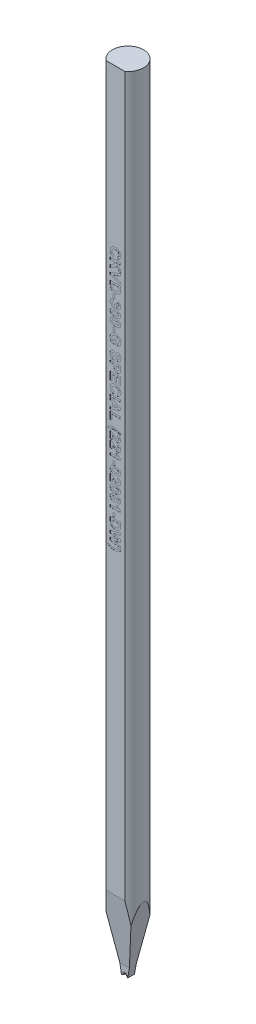
from build123d import *

# Parameters (mm, degrees)
SKETCH_TL_CUTTING_R       = 1.4986
TL_CUTTING_DEPTH          = 75.9968
SKETCH_TDF_GRINDING_W     = 3.0172
SKETCH_TDF_GRINDING_H     = 3.0172
TDF_GRINDING_DEPTH        = 77.026345527
SKETCH_ENGRAVING_W        = 0.166666667
SKETCH_ENGRAVING_H        = 0.371794872
SKETCH_ENGRAVING_W_2      = 1
SKETCH_ENGRAVING_H_2      = 0.192307693
ENGRAVING_DEPTH           = 0.005
VW_VR_GRINDING_DEPTH      = 1.5086
VW_VR_GRINDING_DEPTH_BACK = 1.5086
ISA_GRINDING_DEPTH        = 1.5086
ISA_GRINDING_DEPTH_BACK   = 1.5086
PRE_FRX_BRX_DEPTH         = 1.5086
PRE_FRX_BRX_DEPTH_BACK    = 1.5086
SKETCH_PRE_FRX_BRX_W      = 1.18348
SKETCH_PRE_FRX_BRX_H      = 0.89916
FR_EDM_R                  = 0.14986
BR_EDM_R                  = 0.14986
FA_BA_GRINDING_DEPTH      = 1.5086
FA_BA_GRINDING_DEPTH_BACK = 1.5086


with BuildPart() as part:
    # sketch_TL_cutting → TL_cutting (new body)
    with BuildSketch(Plane(origin=(0, 0, 0), x_dir=(1, 0, 0), z_dir=(0, 1, 0))):
        Circle(SKETCH_TL_CUTTING_R)
    extrude(amount=TL_CUTTING_DEPTH)

    # sketch_TDF_grinding → TDF_grinding (cut, through all)
    with BuildSketch(Plane(origin=(0, 0, 0), x_dir=(1, 0, 0), z_dir=(0, 1, 0))):
        with Locations((0, -2.71002)):
            Rectangle(SKETCH_TDF_GRINDING_W, SKETCH_TDF_GRINDING_H)
    extrude(amount=TDF_GRINDING_DEPTH, mode=Mode.SUBTRACT)

    # sketch_engraving → engraving (cut)
    # profile 1 of 31: a face of its own
    with BuildSketch(Plane.XY.offset(1.20142)):
        with BuildLine():
            Line((-0.128205128, 60.253210256), (-0.192307692, 60.060902564))
            add(Edge.make_bspline(
                [(-0.192307692, 60.060902564), (-0.204917923, 60.064809052), (-0.229612721, 60.072459184), (-0.2649877, 60.086537804), (-0.297871332, 60.102532008), (-0.328259475, 60.120359875), (-0.356049464, 60.140095258), (-0.381471598, 60.161589244), (-0.404368127, 60.185053424), (-0.424673345, 60.210470624), (-0.442633936, 60.237563711), (-0.457816548, 60.266656053), (-0.470893242, 60.29731117), (-0.481488041, 60.329840557), (-0.489972889, 60.364028151), (-0.495577171, 60.400034413), (-0.499377062, 60.437690896), (-0.499789062, 60.463403283), (-0.5, 60.476567628)],
                knots=[0, 0, 0, 0, 1.126670901, 2.206376047, 3.246533763, 4.245677351, 5.210506282, 6.152793389, 7.083980095, 8.004497442, 8.926231833, 9.854395169, 10.801995143, 11.768203916, 12.771938831, 13.805609698, 14.87650608, 16, 16, 16, 16], degree=3))
            add(Edge.make_bspline(
                [(-0.5, 60.476567628), (-0.499663994, 60.492816309), (-0.499003061, 60.524777949), (-0.492350465, 60.571519052), (-0.481969511, 60.616060328), (-0.467601869, 60.658469613), (-0.448555271, 60.698448786), (-0.42571373, 60.736373108), (-0.398318662, 60.771809391), (-0.367249987, 60.804950716), (-0.332452821, 60.835079196), (-0.294134751, 60.861072297), (-0.253074131, 60.883610491), (-0.208709772, 60.901536594), (-0.161353037, 60.915621791), (-0.110975156, 60.925468328), (-0.057578507, 60.931634942), (-0.020984357, 60.932337083), (-0.002203526, 60.932697436)],
                knots=[0, 0, 0, 0, 1.025134988, 2.016471176, 2.973446247, 3.909197306, 4.836872559, 5.763618465, 6.698581235, 7.658772073, 8.627106982, 9.597494692, 10.576422683, 11.578339294, 12.6118974, 13.690673505, 14.814808564, 16, 16, 16, 16], degree=3))
            add(Edge.make_bspline(
                [(-0.002203526, 60.932697436), (0.017576475, 60.9323292), (0.056163648, 60.931610839), (0.112313555, 60.925562878), (0.165084042, 60.915516768), (0.214577853, 60.901940058), (0.260470573, 60.883729249), (0.303160692, 60.861873909), (0.342311169, 60.835756152), (0.377833814, 60.805831091), (0.409480853, 60.772697852), (0.437377469, 60.736993428), (0.460593243, 60.698491041), (0.479896446, 60.657667336), (0.494630503, 60.614223397), (0.505304611, 60.568276602), (0.511505561, 60.519806054), (0.512376199, 60.48666808), (0.512820513, 60.469756731)],
                knots=[0, 0, 0, 0, 1.212773307, 2.365899439, 3.458117515, 4.504331001, 5.50806732, 6.480562534, 7.440239902, 8.387651817, 9.323121479, 10.245404239, 11.160468186, 12.07454208, 13.009500751, 13.96802424, 14.963018902, 16, 16, 16, 16], degree=3))
            add(Edge.make_bspline(
                [(0.512820513, 60.469756731), (0.512448361, 60.454987276), (0.511718707, 60.426029796), (0.506761415, 60.383624506), (0.498061698, 60.343436158), (0.486319015, 60.305247521), (0.470821797, 60.269275987), (0.451884357, 60.235457111), (0.429606892, 60.203674651), (0.412205553, 60.184525065), (0.403445513, 60.174884936)],
                knots=[0, 0, 0, 0, 1.098510076, 2.153775193, 3.169777012, 4.153122333, 5.120892526, 6.076995459, 7.031936742, 8, 8, 8, 8], degree=3))
            add(Edge.make_bspline(
                [(0.403445513, 60.174884936), (0.39787141, 60.169297644), (0.386592274, 60.157991818), (0.367549896, 60.142895368), (0.347050772, 60.128582058), (0.324745215, 60.115279068), (0.30046466, 60.103406849), (0.274581981, 60.092394097), (0.246997406, 60.082255069), (0.227800247, 60.076616604), (0.217948718, 60.073723077)],
                knots=[0, 0, 0, 0, 0.885292881, 1.791380647, 2.722937556, 3.69093542, 4.703306561, 5.754477758, 6.847650944, 8, 8, 8, 8], degree=3))
            Line((0.217948718, 60.073723077), (0.179487179, 60.266030769))
            add(Edge.make_bspline(
                [(0.179487179, 60.266030769), (0.1857949, 60.267665288), (0.198219456, 60.270884861), (0.21607256, 60.27739955), (0.233014714, 60.284871208), (0.248625569, 60.2941361), (0.263619506, 60.303962074), (0.277222328, 60.315624773), (0.290109132, 60.328129754), (0.301694454, 60.342018861), (0.312145605, 60.356893589), (0.321339918, 60.372603983), (0.329014435, 60.389188478), (0.335156827, 60.406521754), (0.340319842, 60.424545702), (0.34350638, 60.443432147), (0.345953545, 60.463015752), (0.3460861, 60.476358875), (0.346153846, 60.483178205)],
                knots=[0, 0, 0, 0, 1.051114734, 2.070420253, 3.064047898, 4.034553068, 4.997066449, 5.953344811, 6.921213386, 7.892675544, 8.867420182, 9.852654213, 10.826683617, 11.811917648, 12.818610352, 13.848120519, 14.900229319, 16, 16, 16, 16], degree=3))
            add(Edge.make_bspline(
                [(0.346153846, 60.483178205), (0.345958725, 60.492542256), (0.345576529, 60.51088423), (0.341532101, 60.53761448), (0.335695112, 60.563055692), (0.326982094, 60.58711706), (0.315677399, 60.609731698), (0.302244603, 60.631228905), (0.286035184, 60.651060806), (0.26758257, 60.669699764), (0.246135655, 60.686407721), (0.221779967, 60.701110652), (0.194212535, 60.713304121), (0.163711493, 60.723204409), (0.130202077, 60.730996736), (0.093641969, 60.736561162), (0.054005962, 60.739638434), (0.026581025, 60.740133903), (0.012419872, 60.740389744)],
                knots=[0, 0, 0, 0, 0.93816214, 1.837638998, 2.704791736, 3.551915875, 4.396257554, 5.235807848, 6.087970119, 6.959042444, 7.860386085, 8.80649345, 9.804409709, 10.875695391, 12.017327537, 13.250155505, 14.580089023, 16, 16, 16, 16], degree=3))
            add(Edge.make_bspline(
                [(0.012419872, 60.740389744), (-0.002609028, 60.740136423), (-0.031567402, 60.739648312), (-0.073337178, 60.736571685), (-0.111754322, 60.730971705), (-0.14688701, 60.723282849), (-0.178713725, 60.713332973), (-0.207179389, 60.701159106), (-0.23231734, 60.686686701), (-0.254110839, 60.669938275), (-0.272831387, 60.651337256), (-0.288926796, 60.631387439), (-0.302688307, 60.610206524), (-0.314010391, 60.587667053), (-0.322575422, 60.563683298), (-0.328786932, 60.538452371), (-0.332735688, 60.511881695), (-0.333131326, 60.493675799), (-0.333333333, 60.484380128)],
                knots=[0, 0, 0, 0, 1.475208372, 2.842499301, 4.107722225, 5.282836115, 6.369007568, 7.375918121, 8.315702116, 9.208439171, 10.065831443, 10.90006451, 11.71996243, 12.54067204, 13.369972975, 14.214060185, 15.088124569, 16, 16, 16, 16], degree=3))
            add(Edge.make_bspline(
                [(-0.333333333, 60.484380128), (-0.333161634, 60.477497953), (-0.332824013, 60.463965176), (-0.330681155, 60.443962689), (-0.326591822, 60.42476438), (-0.321184418, 60.406276281), (-0.314399721, 60.388426559), (-0.305696319, 60.37148748), (-0.295693052, 60.355125777), (-0.283969989, 60.33968094), (-0.270808612, 60.324946156), (-0.255597341, 60.311507159), (-0.238701667, 60.299041373), (-0.220008678, 60.287706947), (-0.199678377, 60.27712516), (-0.177394008, 60.268122121), (-0.153515697, 60.259734984), (-0.136789345, 60.255423153), (-0.128205128, 60.253210256)],
                knots=[0, 0, 0, 0, 0.980177776, 1.927374078, 2.859849964, 3.771585772, 4.668674471, 5.574490016, 6.479656464, 7.396337719, 8.332153134, 9.288470092, 10.28125149, 11.318486971, 12.398724812, 13.541284404, 14.738150009, 16, 16, 16, 16], degree=3))
        make_face()
    # profile 2 of 31: a face of its own
    with BuildSketch(Plane.XY.offset(1.20142)):
        Polygon((-0.5, 59.894235897), (0.5, 59.894235897), (0.5, 59.701928205), (0.052283654, 59.701928205), (0.5, 59.280253526), (0.5, 59.016030769), (0.11338141, 59.395838462), (-0.5, 59.003210256), (-0.5, 59.259420192), (-0.035456731, 59.541671795), (-0.198517628, 59.701928205), (-0.5, 59.701928205), align=None)
    # profile 3 of 31: a face of its own
    with BuildSketch(Plane.XY.offset(1.20142)):
        Polygon((-0.5, 58.627008333), (0.5, 58.9968), (0.5, 58.793675), (-0.243589744, 58.528851282), (0.5, 58.265029167), (0.5, 58.060902564), (-0.5, 58.429291987), align=None)
    # profile 4 of 31: a face of its own
    with BuildSketch(Plane.XY.offset(1.20142)):
        with BuildLine():
            Line((0.5, 57.971158974), (0.5, 57.604372115))
            add(Edge.make_bspline(
                [(0.5, 57.604372115), (0.500005193, 57.594354571), (0.500015306, 57.574848084), (0.498840892, 57.546539066), (0.497659587, 57.520066494), (0.495294873, 57.495506352), (0.492816233, 57.472773432), (0.489678088, 57.451826942), (0.485656212, 57.432799202), (0.482484481, 57.420800319), (0.480969551, 57.415069231)],
                knots=[0, 0, 0, 0, 1.259756885, 2.453039283, 3.563158368, 4.591894114, 5.55549294, 6.43918076, 7.254497783, 8, 8, 8, 8], degree=3))
            add(Edge.make_bspline(
                [(0.480969551, 57.415069231), (0.478637325, 57.407900254), (0.474014881, 57.393691431), (0.465827813, 57.372838378), (0.455960096, 57.353004479), (0.445111978, 57.333729819), (0.432903728, 57.315457553), (0.419595761, 57.297742873), (0.404753223, 57.281109803), (0.383633179, 57.25957514), (0.35420815, 57.235150255), (0.315375005, 57.20931972), (0.272594656, 57.187582014), (0.234409605, 57.172390641), (0.20183843, 57.162346542), (0.175754603, 57.155778141), (0.148301213, 57.150106468), (0.119383738, 57.145856292), (0.08913491, 57.142194906), (0.057465542, 57.139567238), (0.024383276, 57.13826625), (0.001870575, 57.137974494), (-0.009615385, 57.137825641)],
                knots=[0, 0, 0, 0, 0.745431882, 1.477436776, 2.212739876, 2.934276521, 3.663147754, 4.384200836, 5.123377481, 5.865761747, 7.365547505, 8.894711587, 10.468722596, 12.101948761, 12.951987285, 13.837595333, 14.760899389, 15.722756883, 16.726861385, 17.773652936, 18.864119771, 20, 20, 20, 20], degree=3))
            add(Edge.make_bspline(
                [(-0.009615385, 57.137825641), (-0.0294616, 57.138217046), (-0.067834928, 57.13897384), (-0.123301552, 57.144571211), (-0.17465514, 57.153866648), (-0.206804138, 57.163577075), (-0.222355769, 57.168274359)],
                knots=[0, 0, 0, 0, 1.103491527, 2.133638164, 3.0971734, 4, 4, 4, 4], degree=3))
            add(Edge.make_bspline(
                [(-0.222355769, 57.168274359), (-0.231274521, 57.171448003), (-0.248819098, 57.177691057), (-0.274127236, 57.188615932), (-0.298211673, 57.200420337), (-0.321053432, 57.213202184), (-0.342549771, 57.227026052), (-0.362636394, 57.241943645), (-0.381577746, 57.257723731), (-0.393236239, 57.26915549), (-0.399038462, 57.274844872)],
                knots=[0, 0, 0, 0, 1.090884612, 2.145940218, 3.175104604, 4.181306866, 5.161203701, 6.118658341, 7.063689906, 8, 8, 8, 8], degree=3))
            add(Edge.make_bspline(
                [(-0.399038462, 57.274844872), (-0.407300305, 57.284131145), (-0.424264154, 57.303198431), (-0.445652736, 57.33654995), (-0.464086504, 57.374425276), (-0.473760833, 57.401739168), (-0.478766026, 57.415870513)],
                knots=[0, 0, 0, 0, 0.912008655, 1.872605891, 2.89935344, 4, 4, 4, 4], degree=3))
            add(Edge.make_bspline(
                [(-0.478766026, 57.415870513), (-0.4805228, 57.421590486), (-0.484168894, 57.433461996), (-0.488062998, 57.452285444), (-0.492165475, 57.472379947), (-0.49463687, 57.493977223), (-0.497243066, 57.516853081), (-0.498706299, 57.541189822), (-0.49974511, 57.566903081), (-0.499913777, 57.584539175), (-0.5, 57.593554808)],
                knots=[0, 0, 0, 0, 0.799129865, 1.658552685, 2.566799617, 3.538529252, 4.561352959, 5.643373779, 6.795284424, 8, 8, 8, 8], degree=3))
            Line((-0.5, 57.593554808), (-0.5, 57.971158974))
            Line((-0.5, 57.971158974), (0.5, 57.971158974))
        make_face()
        with BuildLine():
            Line((0.333333333, 57.778851282), (-0.333333333, 57.778851282))
            Line((-0.333333333, 57.778851282), (-0.333333333, 57.620598077))
            add(Edge.make_bspline(
                [(-0.333333333, 57.620598077), (-0.333276671, 57.61345336), (-0.333167574, 57.599697049), (-0.332847006, 57.579791316), (-0.331979167, 57.561498115), (-0.331080228, 57.544721614), (-0.329595022, 57.52950549), (-0.328134266, 57.515783535), (-0.326090699, 57.503632132), (-0.324477534, 57.496127127), (-0.323717949, 57.492593269)],
                knots=[0, 0, 0, 0, 1.333384787, 2.567275092, 3.714769766, 4.750907381, 5.701951617, 6.567520054, 7.325492842, 8, 8, 8, 8], degree=3))
            add(Edge.make_bspline(
                [(-0.323717949, 57.492593269), (-0.321509316, 57.484316575), (-0.317207482, 57.468195757), (-0.307617456, 57.445560499), (-0.296048139, 57.425078507), (-0.282136533, 57.40640677), (-0.26455548, 57.38957967), (-0.242070693, 57.375215683), (-0.215254411, 57.361922192), (-0.189584523, 57.352818806), (-0.16665678, 57.346284413), (-0.147412959, 57.341861165), (-0.126593091, 57.338365591), (-0.104279343, 57.335358942), (-0.080500412, 57.332929499), (-0.055170426, 57.331417784), (-0.028320392, 57.330386029), (-0.009883527, 57.330219161), (-0.000400641, 57.330133333)],
                knots=[0, 0, 0, 0, 1.038686998, 2.023088296, 2.974059649, 3.888265163, 4.839857954, 5.909819677, 7.113156087, 8.466843969, 9.20827164, 10.006482943, 10.861893492, 11.769681931, 12.739021491, 13.762258324, 14.849031541, 16, 16, 16, 16], degree=3))
            add(Edge.make_bspline(
                [(-0.000400641, 57.330133333), (0.009082275, 57.3302185), (0.027452469, 57.330383485), (0.054102292, 57.331413664), (0.079033415, 57.332916863), (0.102276578, 57.335363691), (0.123864169, 57.338323456), (0.143813574, 57.341860891), (0.161996804, 57.346254423), (0.183589283, 57.352807511), (0.207947697, 57.362644996), (0.23429421, 57.376471199), (0.2571147, 57.392736402), (0.276689574, 57.411091558), (0.29287817, 57.432178569), (0.306422028, 57.455549371), (0.316938162, 57.481680279), (0.321416742, 57.500269318), (0.323717949, 57.509820833)],
                knots=[0, 0, 0, 0, 1.118059345, 2.165891593, 3.144157881, 4.062285166, 4.920717571, 5.712910489, 6.449981617, 7.12489426, 8.371943983, 9.541298068, 10.624898781, 11.666293176, 12.69306237, 13.747704633, 14.842713931, 16, 16, 16, 16], degree=3))
            add(Edge.make_bspline(
                [(0.323717949, 57.509820833), (0.324486218, 57.513955143), (0.326177652, 57.523057311), (0.328151987, 57.538161571), (0.329628909, 57.555948179), (0.331099472, 57.576377116), (0.331977905, 57.599427064), (0.332859431, 57.625132571), (0.333166326, 57.653516851), (0.333276065, 57.673349207), (0.333333333, 57.683699038)],
                knots=[0, 0, 0, 0, 0.578739524, 1.274162912, 2.095457587, 3.035141998, 4.093102578, 5.270121571, 6.575369351, 8, 8, 8, 8], degree=3))
            Line((0.333333333, 57.683699038), (0.333333333, 57.778851282))
        make_face(mode=Mode.SUBTRACT)
    # profile 5 of 31: a face of its own
    with BuildSketch(Plane.XY.offset(1.20142)):
        with Locations((-0.147435898, 56.810902564)):
            Rectangle(SKETCH_ENGRAVING_W, SKETCH_ENGRAVING_H)
    # profile 6 of 31: a face of its own
    with BuildSketch(Plane.XY.offset(1.20142)):
        with BuildLine():
            Line((-0.215945513, 56.560902564), (-0.192307692, 56.368594872))
            add(Edge.make_bspline(
                [(-0.192307692, 56.368594872), (-0.204132194, 56.366934047), (-0.226576764, 56.363781568), (-0.25764429, 56.353952911), (-0.284674848, 56.341119233), (-0.306838708, 56.324137778), (-0.324372016, 56.30451589), (-0.33711688, 56.28269994), (-0.34490548, 56.258667347), (-0.345732378, 56.241916439), (-0.346153846, 56.233378526)],
                knots=[0, 0, 0, 0, 1.266221457, 2.403466716, 3.446976871, 4.428566981, 5.347951143, 6.225000641, 7.095285456, 8, 8, 8, 8], degree=3))
            add(Edge.make_bspline(
                [(-0.346153846, 56.233378526), (-0.346055611, 56.228763461), (-0.345861023, 56.219621738), (-0.343788926, 56.206189506), (-0.340465357, 56.193318943), (-0.335437029, 56.181131108), (-0.329556159, 56.169386661), (-0.32227181, 56.158136899), (-0.313281658, 56.147822443), (-0.303428531, 56.137759798), (-0.292217285, 56.128828114), (-0.280052259, 56.120960902), (-0.267055651, 56.114054907), (-0.252891939, 56.108702089), (-0.237868043, 56.104512024), (-0.221918716, 56.101516531), (-0.205104086, 56.099693476), (-0.193581061, 56.099475398), (-0.187700321, 56.099364103)],
                knots=[0, 0, 0, 0, 0.951793398, 1.885354025, 2.797928458, 3.688489604, 4.600647717, 5.506538063, 6.445271935, 7.419741996, 8.409776722, 9.395967385, 10.406883209, 11.440832221, 12.514165763, 13.622322902, 14.786559767, 16, 16, 16, 16], degree=3))
            add(Edge.make_bspline(
                [(-0.187700321, 56.099364103), (-0.176786947, 56.099782422), (-0.155968497, 56.100580413), (-0.126418152, 56.106706809), (-0.100528778, 56.117413017), (-0.078485293, 56.132091647), (-0.060832569, 56.149880913), (-0.047691388, 56.169890944), (-0.040013472, 56.192114606), (-0.038982665, 56.207547528), (-0.038461538, 56.215349679)],
                knots=[0, 0, 0, 0, 1.241181749, 2.367689556, 3.413199457, 4.409869786, 5.360751057, 6.245864667, 7.113192516, 8, 8, 8, 8], degree=3))
            add(Edge.make_bspline(
                [(-0.038461538, 56.215349679), (-0.038603641, 56.220903112), (-0.038904883, 56.232675803), (-0.04203482, 56.250987586), (-0.046354275, 56.270956665), (-0.050509304, 56.28455409), (-0.052684295, 56.291671795)],
                knots=[0, 0, 0, 0, 0.854525515, 1.811503923, 2.854410343, 4, 4, 4, 4], degree=3))
            Line((-0.052684295, 56.291671795), (0.102564103, 56.273642949))
            add(Edge.make_bspline(
                [(0.102564103, 56.273642949), (0.102472429, 56.268298846), (0.102294537, 56.257928639), (0.103550083, 56.242785032), (0.10584242, 56.22861013), (0.10956176, 56.215437094), (0.114073964, 56.203253353), (0.119743619, 56.19195343), (0.126797738, 56.181809885), (0.137452935, 56.169474156), (0.153346669, 56.156772172), (0.175381237, 56.145719273), (0.200195104, 56.138963806), (0.217704887, 56.138213684), (0.226762821, 56.137825641)],
                knots=[0, 0, 0, 0, 0.916921599, 1.779281976, 2.604591006, 3.377627834, 4.124827521, 4.832199257, 5.541147775, 6.239830602, 7.625300353, 8.999010263, 10.447566839, 12, 12, 12, 12], degree=3))
            add(Edge.make_bspline(
                [(0.226762821, 56.137825641), (0.234476764, 56.138076334), (0.249283176, 56.138557523), (0.270180788, 56.143795916), (0.288882255, 56.151670608), (0.304586758, 56.163298575), (0.317487731, 56.177454609), (0.326781862, 56.194094939), (0.332438867, 56.212988834), (0.333026806, 56.226259453), (0.333333333, 56.233178205)],
                knots=[0, 0, 0, 0, 1.147344735, 2.202253707, 3.191599761, 4.153119954, 5.090433954, 6.026214277, 6.97094964, 8, 8, 8, 8], degree=3))
            add(Edge.make_bspline(
                [(0.333333333, 56.233178205), (0.332987648, 56.240108214), (0.332308151, 56.253730209), (0.325708071, 56.273198134), (0.315274673, 56.291041507), (0.300599014, 56.306910612), (0.282168696, 56.320609405), (0.259890756, 56.331566627), (0.233746812, 56.338998565), (0.214986903, 56.341591309), (0.205128205, 56.342953846)],
                knots=[0, 0, 0, 0, 0.89036141, 1.750142028, 2.61780756, 3.537452052, 4.514848764, 5.561443886, 6.71849122, 8, 8, 8, 8], degree=3))
            Line((0.205128205, 56.342953846), (0.233974359, 56.535261538))
            add(Edge.make_bspline(
                [(0.233974359, 56.535261538), (0.248657574, 56.532092323), (0.276764536, 56.526025734), (0.316129698, 56.513601503), (0.350961973, 56.499111687), (0.381387831, 56.481841655), (0.408215463, 56.461735814), (0.431647434, 56.43801335), (0.452006068, 56.41068244), (0.469141566, 56.380007941), (0.48286138, 56.346638807), (0.493019554, 56.311130657), (0.49884023, 56.273568376), (0.49960808, 56.247888246), (0.5, 56.234780769)],
                knots=[0, 0, 0, 0, 1.22092895, 2.337131514, 3.351677773, 4.283094182, 5.174661873, 6.069250129, 6.984703325, 7.937694494, 8.918809374, 9.912257166, 10.934388599, 12, 12, 12, 12], degree=3))
            add(Edge.make_bspline(
                [(0.5, 56.234780769), (0.499743324, 56.2236156), (0.499240363, 56.201737211), (0.494922998, 56.169742302), (0.487994845, 56.139386892), (0.478138042, 56.110772682), (0.465473847, 56.083830657), (0.449646388, 56.058807035), (0.431514029, 56.03506228), (0.417247021, 56.021076666), (0.41005609, 56.014027564)],
                knots=[0, 0, 0, 0, 1.090586174, 2.137027055, 3.148380755, 4.128502444, 5.088724121, 6.050075692, 7.017189, 8, 8, 8, 8], degree=3))
            add(Edge.make_bspline(
                [(0.41005609, 56.014027564), (0.403937931, 56.008574347), (0.391853934, 55.997803677), (0.372464834, 55.983852563), (0.352400741, 55.972065213), (0.33177098, 55.962511955), (0.310637907, 55.954751566), (0.288816497, 55.949344728), (0.26639464, 55.946049626), (0.251213033, 55.945695679), (0.243589744, 55.945517949)],
                knots=[0, 0, 0, 0, 1.065686435, 2.104841259, 3.101590809, 4.088754543, 5.058798532, 6.025881737, 7.008716709, 8, 8, 8, 8], degree=3))
            add(Edge.make_bspline(
                [(0.243589744, 55.945517949), (0.232867144, 55.945908156), (0.211730927, 55.946677325), (0.180999661, 55.95378324), (0.151856431, 55.9651029), (0.124562561, 55.981157174), (0.09868881, 56.001390588), (0.075169415, 56.026716452), (0.052695262, 56.055962269), (0.04001359, 56.077965891), (0.033453526, 56.089348077)],
                knots=[0, 0, 0, 0, 0.957658001, 1.887720032, 2.804751961, 3.743912922, 4.709136476, 5.731252806, 6.826406682, 8, 8, 8, 8], degree=3))
            add(Edge.make_bspline(
                [(0.033453526, 56.089348077), (0.031822372, 56.082575609), (0.028603533, 56.069211152), (0.022022537, 56.049914744), (0.01367829, 56.031857672), (0.004232675, 56.014675623), (-0.006542103, 55.998465765), (-0.018789165, 55.983273779), (-0.032819972, 55.969556037), (-0.047679673, 55.956452996), (-0.063887586, 55.944903284), (-0.081022983, 55.934871663), (-0.098866636, 55.926186197), (-0.117582182, 55.919174095), (-0.137087229, 55.913733972), (-0.157475267, 55.910006248), (-0.178623511, 55.907493745), (-0.193034825, 55.907203264), (-0.200320513, 55.90705641)],
                knots=[0, 0, 0, 0, 1.03751577, 2.047382676, 3.031239205, 3.997486026, 4.965932412, 5.927662117, 6.898405035, 7.88572577, 8.876798211, 9.857834218, 10.841137353, 11.829660183, 12.831310853, 13.853692922, 14.91492721, 16, 16, 16, 16], degree=3))
            add(Edge.make_bspline(
                [(-0.200320513, 55.90705641), (-0.2109584, 55.907272661), (-0.231937745, 55.907699137), (-0.2626715, 55.912674881), (-0.292387684, 55.919627328), (-0.320688592, 55.930285264), (-0.348018602, 55.943444593), (-0.373770643, 55.960112865), (-0.398719241, 55.979175045), (-0.421838487, 56.001351285), (-0.443209677, 56.02548231), (-0.461662849, 56.051583574), (-0.477734226, 56.078862651), (-0.490419897, 56.107847217), (-0.500667813, 56.138101873), (-0.507459472, 56.169976996), (-0.512114414, 56.203193455), (-0.512582989, 56.225883302), (-0.512820513, 56.237384936)],
                knots=[0, 0, 0, 0, 1.00633359, 1.984625146, 2.941575753, 3.891818189, 4.841976474, 5.80848851, 6.791183869, 7.810935832, 8.837000052, 9.838854168, 10.83333837, 11.829730352, 12.829487178, 13.852742075, 14.911540725, 16, 16, 16, 16], degree=3))
            add(Edge.make_bspline(
                [(-0.512820513, 56.237384936), (-0.512637793, 56.248283744), (-0.51227889, 56.26969157), (-0.508027091, 56.301030842), (-0.501772194, 56.331046869), (-0.492621954, 56.35956445), (-0.481351422, 56.386831997), (-0.466822586, 56.412334845), (-0.450309361, 56.436729476), (-0.430965435, 56.459218893), (-0.409882535, 56.480129186), (-0.386697234, 56.498496375), (-0.362149526, 56.514863988), (-0.336021778, 56.528941702), (-0.308246096, 56.540611545), (-0.278894175, 56.549698132), (-0.248055897, 56.55694486), (-0.226796469, 56.55956515), (-0.215945513, 56.560902564)],
                knots=[0, 0, 0, 0, 1.077528213, 2.11651914, 3.123276654, 4.10732375, 5.075386463, 6.036572488, 7.005896639, 7.98540975, 8.966414275, 9.939311093, 10.906719916, 11.882103104, 12.870994428, 13.882228509, 14.919075059, 16, 16, 16, 16], degree=3))
        make_face()
    # profile 7 of 31: a face of its own
    with BuildSketch(Plane.XY.offset(1.20142)):
        with BuildLine():
            add(Edge.make_bspline(
                [(0.5, 55.464748718), (0.49971384, 55.452844998), (0.499156721, 55.429669821), (0.494192381, 55.395907508), (0.486315205, 55.364154925), (0.474936732, 55.334405943), (0.460535804, 55.306509267), (0.442472771, 55.280857415), (0.421624591, 55.25685643), (0.405435577, 55.243000797), (0.397235577, 55.235982692)],
                knots=[0, 0, 0, 0, 1.098626248, 2.138899374, 3.143835643, 4.113754749, 5.073488057, 6.034745239, 7.004566348, 8, 8, 8, 8], degree=3))
            add(Edge.make_bspline(
                [(0.397235577, 55.235982692), (0.392013767, 55.231967993), (0.381356969, 55.223774695), (0.364136726, 55.21274029), (0.345869985, 55.202131685), (0.326116385, 55.192873442), (0.305221356, 55.184000078), (0.283126793, 55.175809313), (0.259707844, 55.16857695), (0.235071142, 55.162272124), (0.209179241, 55.156378627), (0.181968999, 55.151441398), (0.15350924, 55.147215972), (0.123831018, 55.143920738), (0.092992495, 55.140966339), (0.060842825, 55.139349757), (0.027454838, 55.138025267), (0.004742429, 55.137892949), (-0.006810897, 55.137825641)],
                knots=[0, 0, 0, 0, 0.746775751, 1.524038446, 2.317840886, 3.141016509, 3.996283186, 4.892488336, 5.812382473, 6.774967264, 7.776368117, 8.823659909, 9.910833035, 11.039122168, 12.210293276, 13.424012874, 14.68964937, 16, 16, 16, 16], degree=3))
            add(Edge.make_bspline(
                [(-0.006810897, 55.137825641), (-0.01836425, 55.137891934), (-0.041009977, 55.138021876), (-0.074330982, 55.139354693), (-0.106413621, 55.140967781), (-0.13725379, 55.143913853), (-0.166926114, 55.147240728), (-0.195353975, 55.151346272), (-0.22243919, 55.156664764), (-0.248289812, 55.162471418), (-0.27303117, 55.168736077), (-0.296407841, 55.1762899), (-0.318777777, 55.184150303), (-0.339699687, 55.193229898), (-0.359477735, 55.202820372), (-0.377930928, 55.213271112), (-0.395257891, 55.224428726), (-0.40597091, 55.232701289), (-0.411258013, 55.236783974)],
                knots=[0, 0, 0, 0, 1.308411734, 2.564617834, 3.776541518, 4.94597967, 6.0725993, 7.15816376, 8.197872509, 9.197791611, 10.158952087, 11.086962723, 11.979249638, 12.843171697, 13.668427753, 14.467630577, 15.243743175, 16, 16, 16, 16], degree=3))
            add(Edge.make_bspline(
                [(-0.411258013, 55.236783974), (-0.419387722, 55.243737875), (-0.435436162, 55.257465209), (-0.456111536, 55.281200465), (-0.473801555, 55.3068109), (-0.487914093, 55.334657064), (-0.499368982, 55.364261236), (-0.506993451, 55.396065546), (-0.511967929, 55.429735616), (-0.512532265, 55.452911213), (-0.512820513, 55.464748718)],
                knots=[0, 0, 0, 0, 0.991667276, 1.957599061, 2.911530233, 3.873218945, 4.847995157, 5.850445929, 6.902062539, 8, 8, 8, 8], degree=3))
            add(Edge.make_bspline(
                [(-0.512820513, 55.464748718), (-0.512476011, 55.476721133), (-0.511800941, 55.500181702), (-0.506449472, 55.534435149), (-0.497876451, 55.566994622), (-0.485636462, 55.597743234), (-0.469774335, 55.626636989), (-0.45076002, 55.653901616), (-0.427732542, 55.678943948), (-0.40629523, 55.698549361), (-0.386925042, 55.712892741), (-0.37086259, 55.723009036), (-0.353675124, 55.732785358), (-0.33482528, 55.741223499), (-0.314870578, 55.749548475), (-0.293380967, 55.756921787), (-0.270541238, 55.763426959), (-0.246455682, 55.769534901), (-0.220958398, 55.774628025), (-0.194124629, 55.779312952), (-0.165840258, 55.783004927), (-0.136262825, 55.786278243), (-0.105322509, 55.788582844), (-0.073069943, 55.790454475), (-0.039401887, 55.791392969), (-0.01649349, 55.791577608), (-0.004807692, 55.791671795)],
                knots=[0, 0, 0, 0, 1.257818097, 2.464759732, 3.634271214, 4.790227596, 5.933394726, 7.09190477, 8.274482889, 9.50191983, 10.139172818, 10.805000628, 11.49619854, 12.215266328, 12.973768034, 13.768328009, 14.601232062, 15.469317089, 16.379095881, 17.333267023, 18.331755967, 19.376479622, 20.460535752, 21.592206075, 22.771760786, 24, 24, 24, 24], degree=3))
            add(Edge.make_bspline(
                [(-0.004807692, 55.791671795), (0.006678925, 55.791606), (0.02919122, 55.791477052), (0.062378132, 55.790134948), (0.094328674, 55.788541634), (0.12509981, 55.78556902), (0.154640959, 55.782269515), (0.183004063, 55.778156894), (0.209982531, 55.772738814), (0.235876189, 55.767389743), (0.260431507, 55.760649782), (0.2837906, 55.753224475), (0.306110518, 55.745390136), (0.326924245, 55.736217854), (0.346659803, 55.726682898), (0.365109758, 55.716224838), (0.382437536, 55.705069066), (0.39315045, 55.696796265), (0.3984375, 55.692713462)],
                knots=[0, 0, 0, 0, 1.304443357, 2.556541329, 3.771813033, 4.936929721, 6.066661712, 7.147723817, 8.190304831, 9.191350322, 10.149780912, 11.080355239, 11.975107155, 12.834450748, 13.66198663, 14.463397305, 15.241653965, 16, 16, 16, 16], degree=3))
            add(Edge.make_bspline(
                [(0.3984375, 55.692713462), (0.406566428, 55.685759179), (0.422613323, 55.672031089), (0.443299998, 55.648301361), (0.460913987, 55.622719209), (0.475197493, 55.594954301), (0.486497465, 55.565282107), (0.494183265, 55.533436121), (0.499144648, 55.499760686), (0.499710816, 55.476585839), (0.5, 55.464748718)],
                knots=[0, 0, 0, 0, 0.991631672, 1.957528776, 2.911425699, 3.867574088, 4.848108326, 5.850523106, 6.902101959, 8, 8, 8, 8], degree=3))
        make_face()
        with BuildLine():
            add(Edge.make_bspline(
                [(0.333333333, 55.464748718), (0.333068079, 55.470916684), (0.332548986, 55.482987158), (0.328316127, 55.500542094), (0.321759633, 55.517123165), (0.312130705, 55.532681206), (0.299093083, 55.54708978), (0.281476094, 55.559297658), (0.259881539, 55.569851162), (0.243736, 55.575130771), (0.235176282, 55.577929808)],
                knots=[0, 0, 0, 0, 0.909107913, 1.77908945, 2.650019014, 3.530482969, 4.465025013, 5.495890128, 6.672421267, 8, 8, 8, 8], degree=3))
            add(Edge.make_bspline(
                [(0.235176282, 55.577929808), (0.228718042, 55.579677997), (0.214837576, 55.583435317), (0.192206647, 55.58769972), (0.166522939, 55.591216485), (0.137792419, 55.594186038), (0.105999886, 55.596602628), (0.071125109, 55.598090848), (0.033192525, 55.599119478), (0.006878451, 55.599280391), (-0.006810897, 55.599364103)],
                knots=[0, 0, 0, 0, 0.658986521, 1.416336438, 2.266694271, 3.212608458, 4.261595115, 5.407496572, 6.651304179, 8, 8, 8, 8], degree=3))
            add(Edge.make_bspline(
                [(-0.006810897, 55.599364103), (-0.020433943, 55.599373117), (-0.046549094, 55.599390397), (-0.084006477, 55.598216163), (-0.118154033, 55.59704872), (-0.148991056, 55.594679061), (-0.176626244, 55.592340892), (-0.200847568, 55.588803343), (-0.221857789, 55.585250608), (-0.244486895, 55.579217153), (-0.268257705, 55.570901394), (-0.292448985, 55.559672977), (-0.311537375, 55.547007058), (-0.325415776, 55.532475587), (-0.334597404, 55.516730329), (-0.341538269, 55.500426395), (-0.345246665, 55.482874555), (-0.345848983, 55.470840013), (-0.346153846, 55.464748718)],
                knots=[0, 0, 0, 0, 1.613038927, 3.092168624, 4.43749063, 5.658264602, 6.75425577, 7.720394221, 8.556328411, 9.275513998, 10.490872946, 11.534172084, 12.42681833, 13.187531851, 13.88996177, 14.574222125, 15.278341114, 16, 16, 16, 16], degree=3))
            add(Edge.make_bspline(
                [(-0.346153846, 55.464748718), (-0.345874419, 55.45865088), (-0.345321688, 55.446588799), (-0.341225408, 55.429056833), (-0.334465655, 55.412499336), (-0.325029126, 55.396836493), (-0.311901617, 55.38241441), (-0.294300445, 55.370197614), (-0.272700888, 55.35964693), (-0.25655611, 55.354366893), (-0.247996795, 55.351567628)],
                knots=[0, 0, 0, 0, 0.899391665, 1.779078861, 2.640979247, 3.529945348, 4.464599804, 5.495588918, 6.672261578, 8, 8, 8, 8], degree=3))
            add(Edge.make_bspline(
                [(-0.247996795, 55.351567628), (-0.241538043, 55.349821968), (-0.227719754, 55.346087186), (-0.205229709, 55.341792396), (-0.179679092, 55.33826611), (-0.151079269, 55.335324791), (-0.11935541, 55.332884431), (-0.084546407, 55.331408845), (-0.046680798, 55.330379247), (-0.020433482, 55.330217356), (-0.006810897, 55.330133333)],
                knots=[0, 0, 0, 0, 0.66114423, 1.414496391, 2.261103113, 3.210114492, 4.255954433, 5.405607896, 6.653488082, 8, 8, 8, 8], degree=3))
            add(Edge.make_bspline(
                [(-0.006810897, 55.330133333), (0.006810741, 55.330247109), (0.032921137, 55.330465199), (0.070464093, 55.331092091), (0.104645163, 55.332847006), (0.13553417, 55.334603226), (0.163028833, 55.337568631), (0.187277888, 55.340511537), (0.208178651, 55.344583667), (0.23096624, 55.350175697), (0.254848985, 55.35851368), (0.278913284, 55.37008584), (0.298191428, 55.38252291), (0.312146257, 55.397029879), (0.321683592, 55.412748044), (0.328364426, 55.429200374), (0.332523972, 55.446649531), (0.333060584, 55.45864941), (0.333333333, 55.464748718)],
                knots=[0, 0, 0, 0, 1.611458614, 3.088895909, 4.441089836, 5.660086535, 6.747875232, 7.711965119, 8.548505902, 9.26500436, 10.486583113, 11.532259092, 12.419544583, 13.184925779, 13.890764661, 14.581638641, 15.279074115, 16, 16, 16, 16], degree=3))
        make_face(mode=Mode.SUBTRACT)
    # profile 8 of 31: a face of its own
    with BuildSketch(Plane.XY.offset(1.20142)):
        with BuildLine():
            add(Edge.make_bspline(
                [(0.5, 54.695517949), (0.49971384, 54.683614229), (0.499156721, 54.660439051), (0.494192381, 54.626676739), (0.486315205, 54.594924156), (0.474936732, 54.565175173), (0.460535804, 54.537278497), (0.442472771, 54.511626646), (0.421624591, 54.487625661), (0.405435577, 54.473770028), (0.397235577, 54.466751923)],
                knots=[0, 0, 0, 0, 1.098626248, 2.138899374, 3.143835643, 4.113754749, 5.073488057, 6.034745239, 7.004566348, 8, 8, 8, 8], degree=3))
            add(Edge.make_bspline(
                [(0.397235577, 54.466751923), (0.392013767, 54.462737224), (0.381356969, 54.454543926), (0.364136726, 54.44350952), (0.345869985, 54.432900915), (0.326116385, 54.423642673), (0.305221356, 54.414769309), (0.283126793, 54.406578544), (0.259707844, 54.39934618), (0.235071142, 54.393041354), (0.209179241, 54.387147858), (0.181968999, 54.382210628), (0.15350924, 54.377985203), (0.123831018, 54.374689969), (0.092992495, 54.37173557), (0.060842825, 54.370118988), (0.027454838, 54.368794498), (0.004742429, 54.368662179), (-0.006810897, 54.368594872)],
                knots=[0, 0, 0, 0, 0.746775751, 1.524038446, 2.317840886, 3.141016509, 3.996283186, 4.892488336, 5.812382473, 6.774967264, 7.776368117, 8.823659909, 9.910833035, 11.039122168, 12.210293276, 13.424012874, 14.68964937, 16, 16, 16, 16], degree=3))
            add(Edge.make_bspline(
                [(-0.006810897, 54.368594872), (-0.01836425, 54.368661165), (-0.041009977, 54.368791107), (-0.074330982, 54.370123924), (-0.106413621, 54.371737012), (-0.13725379, 54.374683084), (-0.166926114, 54.378009959), (-0.195353975, 54.382115503), (-0.22243919, 54.387433995), (-0.248289812, 54.393240649), (-0.27303117, 54.399505308), (-0.296407841, 54.407059131), (-0.318777777, 54.414919533), (-0.339699687, 54.423999129), (-0.359477735, 54.433589602), (-0.377930928, 54.444040342), (-0.395257891, 54.455197957), (-0.40597091, 54.46347052), (-0.411258013, 54.467553205)],
                knots=[0, 0, 0, 0, 1.308411734, 2.564617834, 3.776541518, 4.94597967, 6.0725993, 7.15816376, 8.197872509, 9.197791611, 10.158952087, 11.086962723, 11.979249638, 12.843171697, 13.668427753, 14.467630577, 15.243743175, 16, 16, 16, 16], degree=3))
            add(Edge.make_bspline(
                [(-0.411258013, 54.467553205), (-0.419387722, 54.474507105), (-0.435436162, 54.48823444), (-0.456111536, 54.511969695), (-0.473801555, 54.537580131), (-0.487914093, 54.565426295), (-0.499368982, 54.595030467), (-0.506993451, 54.626834777), (-0.511967929, 54.660504847), (-0.512532265, 54.683680444), (-0.512820513, 54.695517949)],
                knots=[0, 0, 0, 0, 0.991667276, 1.957599061, 2.911530233, 3.873218945, 4.847995157, 5.850445929, 6.902062539, 8, 8, 8, 8], degree=3))
            add(Edge.make_bspline(
                [(-0.512820513, 54.695517949), (-0.512476011, 54.707490364), (-0.511800941, 54.730950933), (-0.506449472, 54.765204379), (-0.497876451, 54.797763853), (-0.485636462, 54.828512465), (-0.469774335, 54.85740622), (-0.45076002, 54.884670847), (-0.427732542, 54.909713179), (-0.40629523, 54.929318592), (-0.386925042, 54.943661971), (-0.37086259, 54.953778267), (-0.353675124, 54.963554589), (-0.33482528, 54.97199273), (-0.314870578, 54.980317706), (-0.293380967, 54.987691018), (-0.270541238, 54.99419619), (-0.246455682, 55.000304132), (-0.220958398, 55.005397256), (-0.194124629, 55.010082183), (-0.165840258, 55.013774157), (-0.136262825, 55.017047473), (-0.105322509, 55.019352075), (-0.073069943, 55.021223706), (-0.039401887, 55.0221622), (-0.01649349, 55.022346839), (-0.004807692, 55.022441026)],
                knots=[0, 0, 0, 0, 1.257818097, 2.464759732, 3.634271214, 4.790227596, 5.933394726, 7.09190477, 8.274482889, 9.50191983, 10.139172818, 10.805000628, 11.49619854, 12.215266328, 12.973768034, 13.768328009, 14.601232062, 15.469317089, 16.379095881, 17.333267023, 18.331755967, 19.376479622, 20.460535752, 21.592206075, 22.771760786, 24, 24, 24, 24], degree=3))
            add(Edge.make_bspline(
                [(-0.004807692, 55.022441026), (0.006678925, 55.022375231), (0.02919122, 55.022246282), (0.062378132, 55.020904179), (0.094328674, 55.019310865), (0.12509981, 55.016338251), (0.154640959, 55.013038746), (0.183004063, 55.008926125), (0.209982531, 55.003508045), (0.235876189, 54.998158974), (0.260431507, 54.991419013), (0.2837906, 54.983993706), (0.306110518, 54.976159367), (0.326924245, 54.966987084), (0.346659803, 54.957452128), (0.365109758, 54.946994069), (0.382437536, 54.935838297), (0.39315045, 54.927565495), (0.3984375, 54.923482692)],
                knots=[0, 0, 0, 0, 1.304443357, 2.556541329, 3.771813033, 4.936929721, 6.066661712, 7.147723817, 8.190304831, 9.191350322, 10.149780912, 11.080355239, 11.975107155, 12.834450748, 13.66198663, 14.463397305, 15.241653965, 16, 16, 16, 16], degree=3))
            add(Edge.make_bspline(
                [(0.3984375, 54.923482692), (0.406566428, 54.91652841), (0.422613323, 54.90280032), (0.443299998, 54.879070592), (0.460913987, 54.853488439), (0.475197493, 54.825723532), (0.486497465, 54.796051338), (0.494183265, 54.764205352), (0.499144648, 54.730529916), (0.499710816, 54.70735507), (0.5, 54.695517949)],
                knots=[0, 0, 0, 0, 0.991631672, 1.957528776, 2.911425699, 3.867574088, 4.848108326, 5.850523106, 6.902101959, 8, 8, 8, 8], degree=3))
        make_face()
        with BuildLine():
            add(Edge.make_bspline(
                [(0.333333333, 54.695517949), (0.333068079, 54.701685915), (0.332548986, 54.713756389), (0.328316127, 54.731311325), (0.321759633, 54.747892396), (0.312130705, 54.763450436), (0.299093083, 54.777859011), (0.281476094, 54.790066888), (0.259881539, 54.800620392), (0.243736, 54.805900001), (0.235176282, 54.808699038)],
                knots=[0, 0, 0, 0, 0.909107913, 1.77908945, 2.650019014, 3.530482969, 4.465025013, 5.495890128, 6.672421267, 8, 8, 8, 8], degree=3))
            add(Edge.make_bspline(
                [(0.235176282, 54.808699038), (0.228718042, 54.810447227), (0.214837576, 54.814204548), (0.192206647, 54.818468951), (0.166522939, 54.821985716), (0.137792419, 54.824955269), (0.105999886, 54.827371859), (0.071125109, 54.828860078), (0.033192525, 54.829888709), (0.006878451, 54.830049622), (-0.006810897, 54.830133333)],
                knots=[0, 0, 0, 0, 0.658986521, 1.416336438, 2.266694271, 3.212608458, 4.261595115, 5.407496572, 6.651304179, 8, 8, 8, 8], degree=3))
            add(Edge.make_bspline(
                [(-0.006810897, 54.830133333), (-0.020433943, 54.830142347), (-0.046549094, 54.830159627), (-0.084006477, 54.828985394), (-0.118154033, 54.827817951), (-0.148991056, 54.825448292), (-0.176626244, 54.823110123), (-0.200847568, 54.819572574), (-0.221857789, 54.816019839), (-0.244486895, 54.809986384), (-0.268257705, 54.801670625), (-0.292448985, 54.790442207), (-0.311537375, 54.777776289), (-0.325415776, 54.763244818), (-0.334597404, 54.74749956), (-0.341538269, 54.731195625), (-0.345246665, 54.713643786), (-0.345848983, 54.701609244), (-0.346153846, 54.695517949)],
                knots=[0, 0, 0, 0, 1.613038927, 3.092168624, 4.43749063, 5.658264602, 6.75425577, 7.720394221, 8.556328411, 9.275513998, 10.490872946, 11.534172084, 12.42681833, 13.187531851, 13.88996177, 14.574222125, 15.278341114, 16, 16, 16, 16], degree=3))
            add(Edge.make_bspline(
                [(-0.346153846, 54.695517949), (-0.345874419, 54.689420111), (-0.345321688, 54.67735803), (-0.341225408, 54.659826063), (-0.334465655, 54.643268567), (-0.325029126, 54.627605723), (-0.311901617, 54.613183641), (-0.294300445, 54.600966845), (-0.272700888, 54.590416161), (-0.25655611, 54.585136123), (-0.247996795, 54.582336859)],
                knots=[0, 0, 0, 0, 0.899391665, 1.779078861, 2.640979247, 3.529945348, 4.464599804, 5.495588918, 6.672261578, 8, 8, 8, 8], degree=3))
            add(Edge.make_bspline(
                [(-0.247996795, 54.582336859), (-0.241538043, 54.580591199), (-0.227719754, 54.576856417), (-0.205229709, 54.572561627), (-0.179679092, 54.56903534), (-0.151079269, 54.566094022), (-0.11935541, 54.563653662), (-0.084546407, 54.562178076), (-0.046680798, 54.561148478), (-0.020433482, 54.560986587), (-0.006810897, 54.560902564)],
                knots=[0, 0, 0, 0, 0.66114423, 1.414496391, 2.261103113, 3.210114492, 4.255954433, 5.405607896, 6.653488082, 8, 8, 8, 8], degree=3))
            add(Edge.make_bspline(
                [(-0.006810897, 54.560902564), (0.006810741, 54.56101634), (0.032921137, 54.56123443), (0.070464093, 54.561861322), (0.104645163, 54.563616237), (0.13553417, 54.565372457), (0.163028833, 54.568337861), (0.187277888, 54.571280768), (0.208178651, 54.575352897), (0.23096624, 54.580944928), (0.254848985, 54.58928291), (0.278913284, 54.600855071), (0.298191428, 54.613292141), (0.312146257, 54.62779911), (0.321683592, 54.643517274), (0.328364426, 54.659969605), (0.332523972, 54.677418762), (0.333060584, 54.689418641), (0.333333333, 54.695517949)],
                knots=[0, 0, 0, 0, 1.611458614, 3.088895909, 4.441089836, 5.660086535, 6.747875232, 7.711965119, 8.548505902, 9.26500436, 10.486583113, 11.532259092, 12.419544583, 13.184925779, 13.890764661, 14.581638641, 15.279074115, 16, 16, 16, 16], degree=3))
        make_face(mode=Mode.SUBTRACT)
    # profile 9 of 31: a face of its own
    with BuildSketch(Plane.XY.offset(1.20142)):
        with Locations((-0.147435898, 54.041671795)):
            Rectangle(SKETCH_ENGRAVING_W, SKETCH_ENGRAVING_H)
    # profile 10 of 31: a face of its own
    with BuildSketch(Plane.XY.offset(1.20142)):
        with BuildLine():
            Line((-0.128205128, 53.291671795), (0.038461538, 53.291671795))
            Line((0.038461538, 53.291671795), (0.038461538, 52.855774359))
            Line((0.038461538, 52.855774359), (-0.36338141, 52.855774359))
            add(Edge.make_bspline(
                [(-0.36338141, 52.855774359), (-0.368321434, 52.861260375), (-0.378419843, 52.8724749), (-0.392661125, 52.890772664), (-0.406257259, 52.910916779), (-0.4194836, 52.932785469), (-0.432233696, 52.956423992), (-0.444685123, 52.981738064), (-0.45671611, 53.008774391), (-0.471787381, 53.047007711), (-0.488186169, 53.09622183), (-0.502445448, 53.156387076), (-0.511191227, 53.217028267), (-0.512277771, 53.257589075), (-0.512820513, 53.277849679)],
                knots=[0, 0, 0, 0, 0.581799769, 1.189316438, 1.825828404, 2.496525428, 3.203088405, 3.942228803, 4.719818701, 5.534979611, 7.181138583, 8.803804008, 10.403462225, 12, 12, 12, 12], degree=3))
            add(Edge.make_bspline(
                [(-0.512820513, 53.277849679), (-0.512629241, 53.290542166), (-0.512252188, 53.315562831), (-0.509233571, 53.352501118), (-0.504017902, 53.388218224), (-0.496780719, 53.422650736), (-0.487836372, 53.455901646), (-0.476607913, 53.487854166), (-0.463065488, 53.518474068), (-0.447986133, 53.547990581), (-0.430657849, 53.575843177), (-0.411724289, 53.602087023), (-0.390891397, 53.626467404), (-0.36853351, 53.649196217), (-0.344060025, 53.669844803), (-0.318106216, 53.688926641), (-0.290219674, 53.705985038), (-0.260879177, 53.721311559), (-0.230317098, 53.734940942), (-0.198781008, 53.746443246), (-0.166726875, 53.756526922), (-0.134042675, 53.764814707), (-0.10062201, 53.770901654), (-0.066619552, 53.775633529), (-0.031822841, 53.778175004), (-0.008417054, 53.778624325), (0.003405449, 53.778851282)],
                knots=[0, 0, 0, 0, 1.124897971, 2.217508473, 3.282174662, 4.322209414, 5.334422951, 6.332119154, 7.320662553, 8.300074908, 9.267468154, 10.225199689, 11.165658754, 12.107290334, 13.047749399, 14.00069605, 14.959944213, 15.942088746, 16.933021067, 17.923599838, 18.915715637, 19.910475908, 20.909926025, 21.925232038, 22.952013513, 24, 24, 24, 24], degree=3))
            add(Edge.make_bspline(
                [(0.003405449, 53.778851282), (0.016165747, 53.778667383), (0.041321811, 53.778304838), (0.078501182, 53.775175194), (0.114594914, 53.770327239), (0.149519517, 53.762932247), (0.183523729, 53.754078796), (0.216299841, 53.742734109), (0.248180515, 53.729780661), (0.278688999, 53.714496543), (0.308028284, 53.697613971), (0.335510174, 53.6784304), (0.361403632, 53.6576108), (0.385591047, 53.634967968), (0.407627145, 53.610129007), (0.428063784, 53.583603308), (0.447146094, 53.55540846), (0.457908016, 53.535231736), (0.463341346, 53.525045192)],
                knots=[0, 0, 0, 0, 1.105132952, 2.178694671, 3.229818344, 4.257558797, 5.269123684, 6.27148554, 7.259679084, 8.247804916, 9.224967877, 10.189258471, 11.147685264, 12.101072275, 13.055511435, 14.02039165, 15.000562851, 16, 16, 16, 16], degree=3))
            add(Edge.make_bspline(
                [(0.463341346, 53.525045192), (0.467347168, 53.516957841), (0.475455657, 53.500587618), (0.485329628, 53.474514525), (0.494054347, 53.447146948), (0.500719187, 53.418165473), (0.506115234, 53.387878993), (0.510216979, 53.356137917), (0.512307439, 53.322883708), (0.512647258, 53.300221284), (0.512820513, 53.288666987)],
                knots=[0, 0, 0, 0, 0.887950456, 1.797368171, 2.741221183, 3.713797788, 4.722103116, 5.768966405, 6.862521341, 8, 8, 8, 8], degree=3))
            add(Edge.make_bspline(
                [(0.512820513, 53.288666987), (0.512598613, 53.273769487), (0.512167059, 53.244796604), (0.508571106, 53.20255631), (0.502373597, 53.162802674), (0.493837942, 53.125480334), (0.482863355, 53.090669697), (0.469371425, 53.058430687), (0.453633675, 53.028565429), (0.435019378, 53.001506485), (0.414494937, 52.976703918), (0.392035387, 52.954222449), (0.367607461, 52.934053031), (0.341334074, 52.916182318), (0.313106625, 52.900750967), (0.283182558, 52.887482952), (0.251334696, 52.876561769), (0.22921692, 52.871283803), (0.217948718, 52.868594872)],
                knots=[0, 0, 0, 0, 1.271135529, 2.472123572, 3.614091059, 4.701890498, 5.736279567, 6.724681829, 7.680621489, 8.611506429, 9.52200816, 10.424540711, 11.318996785, 12.221421405, 13.131851814, 14.060431888, 15.011860567, 16, 16, 16, 16], degree=3))
            Line((0.217948718, 52.868594872), (0.179487179, 53.060902564))
            add(Edge.make_bspline(
                [(0.179487179, 53.060902564), (0.185798707, 53.062805146), (0.198251232, 53.066558905), (0.216108293, 53.073865481), (0.232994438, 53.082183603), (0.248643132, 53.092010597), (0.263649233, 53.102448251), (0.277161531, 53.114718435), (0.290187329, 53.127625453), (0.301701762, 53.142116609), (0.312086782, 53.157555164), (0.321450083, 53.173776632), (0.329043783, 53.191144974), (0.335153652, 53.209417597), (0.340342569, 53.228505002), (0.343533767, 53.24865634), (0.345940549, 53.2696453), (0.346081986, 53.283985325), (0.346153846, 53.291271154)],
                knots=[0, 0, 0, 0, 1.027780279, 2.027791312, 3.006028774, 3.96000864, 4.908113241, 5.852721087, 6.802883308, 7.765918715, 8.733730415, 9.704005314, 10.683351261, 11.68471758, 12.707948499, 13.764514378, 14.864202456, 16, 16, 16, 16], degree=3))
            add(Edge.make_bspline(
                [(0.346153846, 53.291271154), (0.345859633, 53.302298511), (0.34528545, 53.323819337), (0.341538784, 53.355236876), (0.334873123, 53.384876442), (0.325679114, 53.41281554), (0.313877959, 53.439105391), (0.299029501, 53.463390737), (0.282012344, 53.48627627), (0.262039987, 53.507110747), (0.239645267, 53.52600525), (0.214561065, 53.542361822), (0.186868462, 53.555978599), (0.156706511, 53.567131515), (0.124073954, 53.576011616), (0.088855272, 53.582035764), (0.051104495, 53.585971833), (0.02505068, 53.586349093), (0.01161859, 53.58654359)],
                knots=[0, 0, 0, 0, 1.043810997, 2.037086103, 2.989314757, 3.91471467, 4.817033861, 5.710208705, 6.603920097, 7.511448416, 8.435617211, 9.371747005, 10.338444094, 11.350425613, 12.411431869, 13.5347293, 14.729025275, 16, 16, 16, 16], degree=3))
            add(Edge.make_bspline(
                [(0.01161859, 53.58654359), (-0.002813331, 53.586340916), (-0.03086261, 53.585947007), (-0.071503034, 53.582112106), (-0.109371212, 53.575813885), (-0.14440027, 53.566746527), (-0.176807311, 53.555439264), (-0.206438048, 53.541459735), (-0.233109204, 53.524651899), (-0.256980675, 53.505589064), (-0.278169336, 53.484552253), (-0.296147735, 53.461489293), (-0.31184176, 53.437231086), (-0.32420794, 53.411091286), (-0.33413508, 53.383542798), (-0.341078682, 53.354316769), (-0.345395871, 53.323518498), (-0.345897627, 53.302436945), (-0.346153846, 53.291671795)],
                knots=[0, 0, 0, 0, 1.31821493, 2.562027667, 3.72541598, 4.821825939, 5.863743127, 6.857000185, 7.808227391, 8.737146514, 9.643023621, 10.529087527, 11.404035307, 12.277173472, 13.164790074, 14.074766194, 15.016892606, 16, 16, 16, 16], degree=3))
            add(Edge.make_bspline(
                [(-0.346153846, 53.291671795), (-0.345850315, 53.280768504), (-0.34524035, 53.258857617), (-0.340086045, 53.226036537), (-0.332449955, 53.193036283), (-0.321065283, 53.160643933), (-0.307937779, 53.129257225), (-0.292687307, 53.100091024), (-0.276962331, 53.072698447), (-0.264654274, 53.056185969), (-0.258613782, 53.048082051)],
                knots=[0, 0, 0, 0, 0.993779204, 1.997065276, 3.023588959, 4.078879359, 5.123947549, 6.123456565, 7.079038607, 8, 8, 8, 8], degree=3))
            Line((-0.258613782, 53.048082051), (-0.128205128, 53.048082051))
            Line((-0.128205128, 53.048082051), (-0.128205128, 53.291671795))
        make_face()
    # profile 11 of 31: a face of its own
    with BuildSketch(Plane.XY.offset(1.20142)):
        with BuildLine():
            Line((-0.166666667, 52.330133333), (-0.153846154, 52.137825641))
            add(Edge.make_bspline(
                [(-0.153846154, 52.137825641), (-0.161891279, 52.136292992), (-0.177518424, 52.133315918), (-0.199795017, 52.126712009), (-0.220541784, 52.119405841), (-0.239662803, 52.110792964), (-0.25710555, 52.100927896), (-0.273156714, 52.090137618), (-0.28732832, 52.077894862), (-0.299925293, 52.064563176), (-0.310783278, 52.049989999), (-0.320246275, 52.034289399), (-0.328256178, 52.017368131), (-0.334922245, 51.999290819), (-0.339885492, 51.979877406), (-0.343420115, 51.959309762), (-0.345682646, 51.937554761), (-0.345994208, 51.922687096), (-0.346153846, 51.915069231)],
                knots=[0, 0, 0, 0, 1.20477517, 2.340199137, 3.415898527, 4.440826703, 5.422227366, 6.362763262, 7.28278988, 8.172822029, 9.057410505, 9.952475558, 10.866920142, 11.809098, 12.784128911, 13.811833846, 14.878831738, 16, 16, 16, 16], degree=3))
            add(Edge.make_bspline(
                [(-0.346153846, 51.915069231), (-0.346066367, 51.907050933), (-0.345896216, 51.891454929), (-0.343785338, 51.868854596), (-0.340761278, 51.847722259), (-0.335974263, 51.828244522), (-0.330620744, 51.810057658), (-0.323296559, 51.793613353), (-0.314849171, 51.778645499), (-0.305263574, 51.765192657), (-0.294632459, 51.753452348), (-0.28353392, 51.743181341), (-0.272207737, 51.734235972), (-0.260151301, 51.727195334), (-0.247852227, 51.721497439), (-0.234943611, 51.71773153), (-0.221721863, 51.715187435), (-0.212685699, 51.714895702), (-0.208133013, 51.714748718)],
                knots=[0, 0, 0, 0, 1.417779877, 2.757654889, 4.012140507, 5.189587551, 6.302846416, 7.360586765, 8.365575446, 9.33904572, 10.275781718, 11.161696098, 12.012180333, 12.822428111, 13.625933072, 14.403138519, 15.195454004, 16, 16, 16, 16], degree=3))
            add(Edge.make_bspline(
                [(-0.208133013, 51.714748718), (-0.202439146, 51.715042996), (-0.191320796, 51.715617629), (-0.175220679, 51.719387928), (-0.160658688, 51.726192431), (-0.147071392, 51.735428971), (-0.134926522, 51.748393369), (-0.123459543, 51.764797524), (-0.11316916, 51.785257237), (-0.107424402, 51.800425842), (-0.104366987, 51.808498718)],
                knots=[0, 0, 0, 0, 0.906150226, 1.7694295, 2.610923838, 3.450874087, 4.367551936, 5.419872502, 6.626831617, 8, 8, 8, 8], degree=3))
            add(Edge.make_bspline(
                [(-0.104366987, 51.808498718), (-0.103205903, 51.811962905), (-0.100607587, 51.819715194), (-0.096897182, 51.832941154), (-0.092218385, 51.848926556), (-0.087052561, 51.867819979), (-0.081545375, 51.889582885), (-0.074955523, 51.914008532), (-0.068334023, 51.941467832), (-0.063456004, 51.960680895), (-0.060897436, 51.970758333)],
                knots=[0, 0, 0, 0, 0.521824192, 1.167757792, 1.961731518, 2.901193269, 3.965386864, 5.168422915, 6.514810244, 8, 8, 8, 8], degree=3))
            add(Edge.make_bspline(
                [(-0.060897436, 51.970758333), (-0.0576208, 51.983881849), (-0.051299067, 52.009201528), (-0.040053153, 52.045313187), (-0.028879714, 52.078572685), (-0.016755933, 52.108659788), (-0.004503472, 52.135906368), (0.008737874, 52.159871704), (0.022280434, 52.1810559), (0.032402475, 52.193400422), (0.037259615, 52.199324038)],
                knots=[0, 0, 0, 0, 1.293880989, 2.496331788, 3.617634808, 4.64976062, 5.598842568, 6.473791081, 7.267636666, 8, 8, 8, 8], degree=3))
            add(Edge.make_bspline(
                [(0.037259615, 52.199324038), (0.044137694, 52.206670092), (0.057622804, 52.221072711), (0.079781426, 52.240031522), (0.103188466, 52.255962086), (0.127671148, 52.269074684), (0.153370416, 52.279171137), (0.180114252, 52.286327373), (0.207972454, 52.290959148), (0.22694455, 52.291431789), (0.236578526, 52.291671795)],
                knots=[0, 0, 0, 0, 1.064429417, 2.086912298, 3.078678339, 4.055528992, 5.020032834, 5.993708893, 6.981211098, 8, 8, 8, 8], degree=3))
            add(Edge.make_bspline(
                [(0.236578526, 52.291671795), (0.249044725, 52.291204331), (0.273773943, 52.290277024), (0.310123415, 52.28177467), (0.34519423, 52.26852628), (0.373053378, 52.253173891), (0.394102454, 52.238395366), (0.409316468, 52.226168713), (0.423234984, 52.212478899), (0.436363342, 52.197817469), (0.448421192, 52.181938333), (0.459337354, 52.164821959), (0.469762031, 52.146790204), (0.481724432, 52.120477828), (0.494501972, 52.084946959), (0.505216674, 52.038711911), (0.511620444, 51.988366137), (0.512410831, 51.953416875), (0.512820513, 51.935301603)],
                knots=[0, 0, 0, 0, 1.180224575, 2.341213254, 3.519178081, 4.726056898, 5.344182394, 5.956118988, 6.573855441, 7.192564044, 7.82049682, 8.461345463, 9.116141012, 9.79299132, 11.198532007, 12.687823846, 14.283197644, 16, 16, 16, 16], degree=3))
            add(Edge.make_bspline(
                [(0.512820513, 51.935301603), (0.512622915, 51.920468568), (0.512238592, 51.891618634), (0.508327094, 51.849800661), (0.502300976, 51.810792321), (0.493471523, 51.774657475), (0.482080613, 51.741328087), (0.468307987, 51.710739204), (0.4520288, 51.682971205), (0.433078398, 51.658319232), (0.412189308, 51.636355993), (0.389371716, 51.617196757), (0.364914548, 51.600768024), (0.338835479, 51.586963833), (0.311000478, 51.576123434), (0.281444264, 51.56816159), (0.250236407, 51.562895557), (0.228852471, 51.56157561), (0.217948718, 51.560902564)],
                knots=[0, 0, 0, 0, 1.325136797, 2.577362738, 3.74962816, 4.849499017, 5.896771726, 6.892816139, 7.842473141, 8.766187929, 9.665133525, 10.546015357, 11.42313021, 12.293255665, 13.177485873, 14.086514152, 15.024305989, 16, 16, 16, 16], degree=3))
            Line((0.217948718, 51.560902564), (0.205128205, 51.753210256))
            add(Edge.make_bspline(
                [(0.205128205, 51.753210256), (0.211158714, 51.754319181), (0.22291155, 51.756480361), (0.239739753, 51.761187468), (0.255319488, 51.766468235), (0.269550394, 51.772734545), (0.282452554, 51.779952876), (0.29405422, 51.788157056), (0.304442868, 51.797192928), (0.313348905, 51.807441396), (0.321255295, 51.81866557), (0.327770309, 51.831292058), (0.333732615, 51.844930184), (0.338229411, 51.860091156), (0.341791978, 51.87650001), (0.344434282, 51.894161538), (0.34572413, 51.913113752), (0.346007328, 51.926152118), (0.346153846, 51.932897756)],
                knots=[0, 0, 0, 0, 1.150775252, 2.242741279, 3.277646382, 4.23752694, 5.158201782, 6.048759188, 6.901533576, 7.736611693, 8.592238639, 9.472855288, 10.399741491, 11.383322377, 12.435924598, 13.551250831, 14.733094547, 16, 16, 16, 16], degree=3))
            add(Edge.make_bspline(
                [(0.346153846, 51.932897756), (0.346024502, 51.939911384), (0.345772856, 51.953556709), (0.344228543, 51.973441585), (0.34137789, 51.99209509), (0.337667048, 52.009608838), (0.332618703, 52.025959434), (0.326463073, 52.041112373), (0.319216002, 52.055136981), (0.313514257, 52.063688576), (0.310697115, 52.067913782)],
                knots=[0, 0, 0, 0, 1.186678824, 2.308736671, 3.37120409, 4.377216403, 5.334874112, 6.262130804, 7.141346615, 8, 8, 8, 8], degree=3))
            add(Edge.make_bspline(
                [(0.310697115, 52.067913782), (0.30684882, 52.072749176), (0.299395868, 52.082113832), (0.284596838, 52.092192185), (0.267881777, 52.098259376), (0.256061421, 52.098989631), (0.25, 52.099364103)],
                knots=[0, 0, 0, 0, 1.037857257, 2.010007357, 2.979541333, 4, 4, 4, 4], degree=3))
            add(Edge.make_bspline(
                [(0.25, 52.099364103), (0.244335199, 52.099057853), (0.233176443, 52.098454591), (0.217325189, 52.092369912), (0.202637862, 52.083012505), (0.194659513, 52.074269543), (0.190504808, 52.069716667)],
                knots=[0, 0, 0, 0, 0.98538058, 1.941042925, 2.927803204, 4, 4, 4, 4], degree=3))
            add(Edge.make_bspline(
                [(0.190504808, 52.069716667), (0.187808196, 52.066103373), (0.18178239, 52.058029166), (0.17412302, 52.043238818), (0.165827461, 52.025386481), (0.157717635, 52.004065163), (0.149622864, 51.979416566), (0.141170987, 51.951439191), (0.132605635, 51.92011583), (0.124310512, 51.886244901), (0.116156882, 51.851856369), (0.107242663, 51.81904034), (0.098551989, 51.788526152), (0.089442753, 51.76045529), (0.080574939, 51.734683056), (0.071467056, 51.71133464), (0.062596997, 51.690249725), (0.050400038, 51.665662375), (0.033878763, 51.637795088), (0.009862335, 51.608587027), (-0.017133698, 51.582756224), (-0.042589095, 51.564758007), (-0.064481415, 51.552394174), (-0.081932142, 51.54443317), (-0.100320809, 51.537546277), (-0.119667735, 51.531940365), (-0.140000145, 51.527877428), (-0.161162698, 51.52451511), (-0.183331155, 51.52279724), (-0.198448465, 51.522561042), (-0.206129808, 51.522441026)],
                knots=[0, 0, 0, 0, 0.511875881, 1.143829537, 1.88775736, 2.750598373, 3.734912702, 4.837306479, 6.073130119, 7.42648979, 8.801963576, 10.091065733, 11.292408984, 12.408830014, 13.446061236, 14.39066453, 15.257936293, 16.045629259, 17.510392066, 18.929669597, 20.331293837, 21.746891395, 22.460690638, 23.187651344, 23.925159671, 24.69163991, 25.474819891, 26.281170188, 27.126635539, 28, 28, 28, 28], degree=3))
            add(Edge.make_bspline(
                [(-0.206129808, 51.522441026), (-0.213213723, 51.522606052), (-0.227281693, 51.522933777), (-0.248162112, 51.525224014), (-0.268671734, 51.528765808), (-0.288836268, 51.53400888), (-0.308616053, 51.540964346), (-0.328296541, 51.548795664), (-0.347448635, 51.558588225), (-0.366087841, 51.569733722), (-0.384201522, 51.582026864), (-0.400907086, 51.595960438), (-0.416780552, 51.610701766), (-0.430830184, 51.627206877), (-0.444499814, 51.644290113), (-0.456413626, 51.663066399), (-0.467267368, 51.682934954), (-0.476944445, 51.704076878), (-0.485241283, 51.72656221), (-0.492760445, 51.75025588), (-0.498861937, 51.775381414), (-0.504102567, 51.801768353), (-0.508085093, 51.829519127), (-0.510866581, 51.858597372), (-0.512434986, 51.889010174), (-0.512690407, 51.909725604), (-0.512820513, 51.920277564)],
                knots=[0, 0, 0, 0, 0.900523777, 1.788352984, 2.667658312, 3.544829998, 4.433470602, 5.332071549, 6.235671317, 7.16456001, 8.092361829, 9.015217829, 9.927983376, 10.842405559, 11.767913001, 12.707486241, 13.664840466, 14.644960138, 15.660436429, 16.710285012, 17.80361473, 18.945755434, 20.129541241, 21.366238063, 22.658422763, 24, 24, 24, 24], degree=3))
            add(Edge.make_bspline(
                [(-0.512820513, 51.920277564), (-0.512571769, 51.935512968), (-0.512087459, 51.965176661), (-0.507752501, 52.008272681), (-0.501117535, 52.04869389), (-0.491487967, 52.086374505), (-0.47912575, 52.121360517), (-0.463898318, 52.153636188), (-0.445714308, 52.183044634), (-0.4250161, 52.209952877), (-0.401421388, 52.233992223), (-0.37543806, 52.255637857), (-0.346733609, 52.274470694), (-0.315676999, 52.291000711), (-0.28185988, 52.304489571), (-0.245840091, 52.31601756), (-0.207125792, 52.324594343), (-0.180386288, 52.328255071), (-0.166666667, 52.330133333)],
                knots=[0, 0, 0, 0, 1.217919187, 2.371317543, 3.459749122, 4.490553404, 5.476795534, 6.422548752, 7.338285933, 8.236452553, 9.131296239, 10.026155855, 10.935394819, 11.871650654, 12.834387429, 13.842485342, 14.893012909, 16, 16, 16, 16], degree=3))
        make_face()
    # profile 12 of 31: a face of its own
    with BuildSketch(Plane.XY.offset(1.20142)):
        with BuildLine():
            Line((-0.5, 51.355774359), (0.5, 51.355774359))
            Line((0.5, 51.355774359), (0.5, 51.0358625))
            add(Edge.make_bspline(
                [(0.5, 51.0358625), (0.4999852, 51.021372147), (0.499956962, 50.993724386), (0.499104777, 50.954191754), (0.497929464, 50.918597547), (0.496434625, 50.886930495), (0.494248137, 50.859274026), (0.491629455, 50.835566649), (0.488933209, 50.815699436), (0.486060508, 50.80394182), (0.484775641, 50.798683013)],
                knots=[0, 0, 0, 0, 1.460492613, 2.786636817, 3.985312262, 5.05006335, 5.98179196, 6.7807735, 7.454678796, 8, 8, 8, 8], degree=3))
            add(Edge.make_bspline(
                [(0.484775641, 50.798683013), (0.482781564, 50.791689652), (0.478823789, 50.777809469), (0.470386441, 50.757923495), (0.460608006, 50.738756563), (0.448953875, 50.720549497), (0.435630967, 50.703240356), (0.420747869, 50.686777881), (0.404237636, 50.671073536), (0.386131953, 50.656347457), (0.366525691, 50.642851434), (0.345376234, 50.631220093), (0.322847402, 50.621359617), (0.298873329, 50.613435209), (0.273610941, 50.606883309), (0.246834559, 50.602700716), (0.218752408, 50.599677196), (0.199528035, 50.599469993), (0.189703526, 50.599364103)],
                knots=[0, 0, 0, 0, 0.907183394, 1.800546498, 2.691728384, 3.591410291, 4.495216108, 5.416087871, 6.359626967, 7.337496937, 8.327236581, 9.327316132, 10.346534403, 11.393207653, 12.477041209, 13.600953845, 14.773980723, 16, 16, 16, 16], degree=3))
            add(Edge.make_bspline(
                [(0.189703526, 50.599364103), (0.174784734, 50.599672611), (0.146065241, 50.600266506), (0.104894137, 50.606915955), (0.067280604, 50.61704886), (0.03361575, 50.631889815), (0.003633111, 50.649902901), (-0.023091697, 50.670070707), (-0.046492635, 50.692553937), (-0.066210989, 50.71713317), (-0.082434, 50.743064495), (-0.096247437, 50.769063033), (-0.106871469, 50.795454207), (-0.11149992, 50.813448472), (-0.113782051, 50.822320833)],
                knots=[0, 0, 0, 0, 1.312446177, 2.526530956, 3.662051072, 4.733637382, 5.754065268, 6.735959421, 7.675686778, 8.604015004, 9.502732733, 10.365317746, 11.193993632, 12, 12, 12, 12], degree=3))
            add(Edge.make_bspline(
                [(-0.113782051, 50.822320833), (-0.114986663, 50.828653444), (-0.11752584, 50.842001831), (-0.120056937, 50.863171575), (-0.122858586, 50.886311253), (-0.124685978, 50.911516039), (-0.126397255, 50.938755443), (-0.127205205, 50.968018886), (-0.128178621, 50.99926455), (-0.128196112, 51.020770724), (-0.128205128, 51.03185609)],
                knots=[0, 0, 0, 0, 0.735353946, 1.55003838, 2.431865514, 3.394945452, 4.432993119, 5.54609699, 6.735134699, 8, 8, 8, 8], degree=3))
            Line((-0.128205128, 51.03185609), (-0.128205128, 51.163466667))
            Line((-0.128205128, 51.163466667), (-0.5, 51.163466667))
            Line((-0.5, 51.163466667), (-0.5, 51.355774359))
        make_face()
        with BuildLine():
            Line((0.333333333, 51.163466667), (0.038461538, 51.163466667))
            Line((0.038461538, 51.163466667), (0.038461538, 51.048082051))
            add(Edge.make_bspline(
                [(0.038461538, 51.048082051), (0.038474423, 51.038131925), (0.038499073, 51.019096082), (0.039383856, 50.99178387), (0.040463899, 50.96706083), (0.04225159, 50.944875304), (0.044607724, 50.925361209), (0.047425958, 50.908387865), (0.050450217, 50.893935489), (0.055461898, 50.878307212), (0.063570342, 50.86159746), (0.075224213, 50.843753407), (0.089157789, 50.828077429), (0.105522293, 50.815032937), (0.123704204, 50.804613276), (0.143517189, 50.797152791), (0.164632877, 50.792335563), (0.179260262, 50.791895553), (0.186698718, 50.791671795)],
                knots=[0, 0, 0, 0, 1.411705958, 2.700771114, 3.876961699, 4.922619712, 5.858038221, 6.66485904, 7.363650596, 7.950905807, 8.989198271, 9.987739806, 10.967313358, 11.951275539, 12.944273208, 13.927870418, 14.946261014, 16, 16, 16, 16], degree=3))
            add(Edge.make_bspline(
                [(0.186698718, 50.791671795), (0.195758642, 50.79198671), (0.213324639, 50.792597288), (0.238341551, 50.799330263), (0.261044702, 50.809718473), (0.280727694, 50.824570665), (0.297279472, 50.842511763), (0.31105114, 50.862676808), (0.320688658, 50.885496434), (0.32442284, 50.901646613), (0.326322115, 50.909860897)],
                knots=[0, 0, 0, 0, 1.085904563, 2.105425768, 3.088705091, 4.068969419, 5.045188284, 6.010769642, 6.988240112, 8, 8, 8, 8], degree=3))
            add(Edge.make_bspline(
                [(0.326322115, 50.909860897), (0.326887477, 50.913395692), (0.328142404, 50.921241839), (0.329452077, 50.934283732), (0.330643223, 50.949712293), (0.331621189, 50.967546121), (0.332385732, 50.987714526), (0.333055661, 51.010284032), (0.333109481, 51.0351952), (0.333256648, 51.052622813), (0.333333333, 51.061703846)],
                knots=[0, 0, 0, 0, 0.564603001, 1.253243608, 2.066786758, 3.005752288, 4.070476343, 5.250658742, 6.567396469, 8, 8, 8, 8], degree=3))
            Line((0.333333333, 51.061703846), (0.333333333, 51.163466667))
        make_face(mode=Mode.SUBTRACT)
    # profile 13 of 31: a face of its own
    with BuildSketch(Plane.XY.offset(1.20142)):
        Polygon((-0.5, 50.432697436), (0.5, 50.432697436), (0.5, 49.689107692), (0.333333333, 49.689107692), (0.333333333, 50.240389744), (0.115384615, 50.240389744), (0.115384615, 49.727569231), (-0.051282051, 49.727569231), (-0.051282051, 50.240389744), (-0.333333333, 50.240389744), (-0.333333333, 49.676287179), (-0.5, 49.676287179), align=None)
    # profile 14 of 31: a face of its own
    with BuildSketch(Plane.XY.offset(1.20142)):
        with BuildLine():
            Line((-0.128205128, 48.868594872), (-0.192307692, 48.676287179))
            add(Edge.make_bspline(
                [(-0.192307692, 48.676287179), (-0.204917923, 48.680193667), (-0.229612721, 48.687843799), (-0.2649877, 48.701922419), (-0.297871332, 48.717916624), (-0.328259475, 48.735744491), (-0.356049464, 48.755479873), (-0.381471598, 48.776973859), (-0.404368127, 48.800438039), (-0.424673345, 48.82585524), (-0.442633936, 48.852948327), (-0.457816548, 48.882040669), (-0.470893242, 48.912695786), (-0.481488041, 48.945225172), (-0.489972889, 48.979412767), (-0.495577171, 49.015419029), (-0.499377062, 49.053075511), (-0.499789062, 49.078787899), (-0.5, 49.091952244)],
                knots=[0, 0, 0, 0, 1.126670901, 2.206376047, 3.246533763, 4.245677351, 5.210506282, 6.152793389, 7.083980095, 8.004497442, 8.926231833, 9.854395169, 10.801995143, 11.768203916, 12.771938831, 13.805609698, 14.87650608, 16, 16, 16, 16], degree=3))
            add(Edge.make_bspline(
                [(-0.5, 49.091952244), (-0.499663994, 49.108200924), (-0.499003061, 49.140162564), (-0.492350465, 49.186903667), (-0.481969511, 49.231444943), (-0.467601869, 49.273854229), (-0.448555271, 49.313833401), (-0.42571373, 49.351757723), (-0.398318662, 49.387194006), (-0.367249987, 49.420335331), (-0.332452821, 49.450463811), (-0.294134751, 49.476456912), (-0.253074131, 49.498995107), (-0.208709772, 49.516921209), (-0.161353037, 49.531006406), (-0.110975156, 49.540852944), (-0.057578507, 49.547019557), (-0.020984357, 49.547721699), (-0.002203526, 49.548082051)],
                knots=[0, 0, 0, 0, 1.025134988, 2.016471176, 2.973446247, 3.909197306, 4.836872559, 5.763618465, 6.698581235, 7.658772073, 8.627106982, 9.597494692, 10.576422683, 11.578339294, 12.6118974, 13.690673505, 14.814808564, 16, 16, 16, 16], degree=3))
            add(Edge.make_bspline(
                [(-0.002203526, 49.548082051), (0.017576475, 49.547713815), (0.056163648, 49.546995454), (0.112313555, 49.540947493), (0.165084042, 49.530901384), (0.214577853, 49.517324673), (0.260470573, 49.499113864), (0.303160692, 49.477258524), (0.342311169, 49.451140767), (0.377833814, 49.421215706), (0.409480853, 49.388082467), (0.437377469, 49.352378043), (0.460593243, 49.313875656), (0.479896446, 49.273051952), (0.494630503, 49.229608013), (0.505304611, 49.183661217), (0.511505561, 49.13519067), (0.512376199, 49.102052696), (0.512820513, 49.085141346)],
                knots=[0, 0, 0, 0, 1.212773307, 2.365899439, 3.458117515, 4.504331001, 5.50806732, 6.480562534, 7.440239902, 8.387651817, 9.323121479, 10.245404239, 11.160468186, 12.07454208, 13.009500751, 13.96802424, 14.963018902, 16, 16, 16, 16], degree=3))
            add(Edge.make_bspline(
                [(0.512820513, 49.085141346), (0.512448361, 49.070371892), (0.511718707, 49.041414411), (0.506761415, 48.999009121), (0.498061698, 48.958820773), (0.486319015, 48.920632137), (0.470821797, 48.884660602), (0.451884357, 48.850841727), (0.429606892, 48.819059266), (0.412205553, 48.79990968), (0.403445513, 48.790269551)],
                knots=[0, 0, 0, 0, 1.098510076, 2.153775193, 3.169777012, 4.153122333, 5.120892526, 6.076995459, 7.031936742, 8, 8, 8, 8], degree=3))
            add(Edge.make_bspline(
                [(0.403445513, 48.790269551), (0.39787141, 48.784682259), (0.386592274, 48.773376434), (0.367549896, 48.758279984), (0.347050772, 48.743966673), (0.324745215, 48.730663684), (0.30046466, 48.718791464), (0.274581981, 48.707778712), (0.246997406, 48.697639685), (0.227800247, 48.69200122), (0.217948718, 48.689107692)],
                knots=[0, 0, 0, 0, 0.885292881, 1.791380647, 2.722937556, 3.69093542, 4.703306561, 5.754477758, 6.847650944, 8, 8, 8, 8], degree=3))
            Line((0.217948718, 48.689107692), (0.179487179, 48.881415385))
            add(Edge.make_bspline(
                [(0.179487179, 48.881415385), (0.1857949, 48.883049903), (0.198219456, 48.886269477), (0.21607256, 48.892784165), (0.233014714, 48.900255823), (0.248625569, 48.909520715), (0.263619506, 48.91934669), (0.277222328, 48.931009388), (0.290109132, 48.94351437), (0.301694454, 48.957403477), (0.312145605, 48.972278204), (0.321339918, 48.987988598), (0.329014435, 49.004573093), (0.335156827, 49.02190637), (0.340319842, 49.039930317), (0.34350638, 49.058816762), (0.345953545, 49.078400368), (0.3460861, 49.091743491), (0.346153846, 49.098562821)],
                knots=[0, 0, 0, 0, 1.051114734, 2.070420253, 3.064047898, 4.034553068, 4.997066449, 5.953344811, 6.921213386, 7.892675544, 8.867420182, 9.852654213, 10.826683617, 11.811917648, 12.818610352, 13.848120519, 14.900229319, 16, 16, 16, 16], degree=3))
            add(Edge.make_bspline(
                [(0.346153846, 49.098562821), (0.345958725, 49.107926872), (0.345576529, 49.126268845), (0.341532101, 49.152999095), (0.335695112, 49.178440307), (0.326982094, 49.202501675), (0.315677399, 49.225116313), (0.302244603, 49.246613521), (0.286035184, 49.266445421), (0.26758257, 49.285084379), (0.246135655, 49.301792337), (0.221779967, 49.316495267), (0.194212535, 49.328688736), (0.163711493, 49.338589024), (0.130202077, 49.346381351), (0.093641969, 49.351945777), (0.054005962, 49.355023049), (0.026581025, 49.355518518), (0.012419872, 49.355774359)],
                knots=[0, 0, 0, 0, 0.93816214, 1.837638998, 2.704791736, 3.551915875, 4.396257554, 5.235807848, 6.087970119, 6.959042444, 7.860386085, 8.80649345, 9.804409709, 10.875695391, 12.017327537, 13.250155505, 14.580089023, 16, 16, 16, 16], degree=3))
            add(Edge.make_bspline(
                [(0.012419872, 49.355774359), (-0.002609028, 49.355521038), (-0.031567402, 49.355032928), (-0.073337178, 49.351956301), (-0.111754322, 49.34635632), (-0.14688701, 49.338667464), (-0.178713725, 49.328717589), (-0.207179389, 49.316543722), (-0.23231734, 49.302071317), (-0.254110839, 49.285322891), (-0.272831387, 49.266721872), (-0.288926796, 49.246772054), (-0.302688307, 49.225591139), (-0.314010391, 49.203051668), (-0.322575422, 49.179067913), (-0.328786932, 49.153836986), (-0.332735688, 49.12726631), (-0.333131326, 49.109060415), (-0.333333333, 49.099764744)],
                knots=[0, 0, 0, 0, 1.475208372, 2.842499301, 4.107722225, 5.282836115, 6.369007568, 7.375918121, 8.315702116, 9.208439171, 10.065831443, 10.90006451, 11.71996243, 12.54067204, 13.369972975, 14.214060185, 15.088124569, 16, 16, 16, 16], degree=3))
            add(Edge.make_bspline(
                [(-0.333333333, 49.099764744), (-0.333161634, 49.092882568), (-0.332824013, 49.079349791), (-0.330681155, 49.059347304), (-0.326591822, 49.040148996), (-0.321184418, 49.021660896), (-0.314399721, 49.003811174), (-0.305696319, 48.986872096), (-0.295693052, 48.970510392), (-0.283969989, 48.955065555), (-0.270808612, 48.940330772), (-0.255597341, 48.926891774), (-0.238701667, 48.914425989), (-0.220008678, 48.903091562), (-0.199678377, 48.892509775), (-0.177394008, 48.883506737), (-0.153515697, 48.8751196), (-0.136789345, 48.870807769), (-0.128205128, 48.868594872)],
                knots=[0, 0, 0, 0, 0.980177776, 1.927374078, 2.859849964, 3.771585772, 4.668674471, 5.574490016, 6.479656464, 7.396337719, 8.332153134, 9.288470092, 10.28125149, 11.318486971, 12.398724812, 13.541284404, 14.738150009, 16, 16, 16, 16], degree=3))
        make_face()
    # profile 15 of 31: a face of its own
    with BuildSketch(Plane.XY.offset(1.20142)):
        with Locations((0, 48.42628718)):
            Rectangle(SKETCH_ENGRAVING_W_2, SKETCH_ENGRAVING_H_2)
    # profile 16 of 31: a face of its own
    with BuildSketch(Plane.XY.offset(1.20142)):
        Polygon((-0.5, 47.266030769), (-0.5, 47.469957051), (-0.269230769, 47.554291987), (-0.269230769, 47.93810609), (-0.5, 48.022441026), (-0.5, 48.227569231), (0.5, 47.849564423), (0.5, 47.645838462), align=None)
        Polygon((-0.102564103, 47.615389744), (0.256410256, 47.7468), (-0.102564103, 47.877809615), align=None, mode=Mode.SUBTRACT)
    # profile 17 of 31: a face of its own
    with BuildSketch(Plane.XY.offset(1.20142)):
        Polygon((-0.5, 47.125005128), (0.5, 47.125005128), (0.5, 46.932697436), (-0.333333333, 46.932697436), (-0.333333333, 46.419876923), (-0.5, 46.419876923), align=None)
    # profile 18 of 31: a face of its own
    with BuildSketch(Plane.XY.offset(1.20142)):
        with BuildLine():
            Line((-0.769230769, 45.599364103), (-0.769230769, 45.714748718))
            add(Edge.make_bspline(
                [(-0.769230769, 45.714748718), (-0.75654381, 45.723463826), (-0.731271202, 45.74082445), (-0.692407522, 45.764908744), (-0.653253405, 45.787607931), (-0.61390654, 45.808857444), (-0.574088198, 45.828394152), (-0.533834647, 45.84607299), (-0.493399806, 45.862682514), (-0.452559629, 45.877179278), (-0.411730957, 45.890172472), (-0.37117072, 45.901733672), (-0.330720232, 45.910967297), (-0.290776237, 45.919212038), (-0.251027852, 45.925072807), (-0.211754164, 45.929565375), (-0.172781576, 45.932268765), (-0.146905785, 45.932554889), (-0.134014423, 45.932697436)],
                knots=[0, 0, 0, 0, 1.083507766, 2.158363427, 3.217863588, 4.26952313, 5.306027247, 6.339424422, 7.364296331, 8.382863073, 9.389381803, 10.380601174, 11.351000725, 12.30983044, 13.25126181, 14.178453692, 15.092502614, 16, 16, 16, 16], degree=3))
            add(Edge.make_bspline(
                [(-0.134014423, 45.932697436), (-0.118183889, 45.932520886), (-0.086756823, 45.932170396), (-0.039956705, 45.928872127), (0.006211299, 45.923393151), (0.051774559, 45.916131702), (0.096653064, 45.906351161), (0.140935004, 45.89478945), (0.184649405, 45.881083306), (0.2131297, 45.870085182), (0.227363782, 45.864588462)],
                knots=[0, 0, 0, 0, 1.026825403, 2.038472649, 3.041589395, 4.042121555, 5.030199178, 6.019908545, 7.010375948, 8, 8, 8, 8], degree=3))
            add(Edge.make_bspline(
                [(0.227363782, 45.864588462), (0.251683724, 45.85442748), (0.300012726, 45.834235406), (0.369571494, 45.798374678), (0.43660795, 45.759137941), (0.478889333, 45.72953111), (0.5, 45.714748718)],
                knots=[0, 0, 0, 0, 1.013799707, 2.014640032, 3.00872983, 4, 4, 4, 4], degree=3))
            Line((0.5, 45.714748718), (0.5, 45.599364103))
            add(Edge.make_bspline(
                [(0.5, 45.599364103), (0.483671183, 45.605920598), (0.451734259, 45.618744202), (0.404403907, 45.636204634), (0.359131946, 45.652565299), (0.315658143, 45.667213628), (0.273946214, 45.68018068), (0.234213299, 45.69193527), (0.196217088, 45.701681677), (0.148045143, 45.713044778), (0.087918925, 45.724128711), (0.014547585, 45.733386625), (-0.060927268, 45.739501265), (-0.111967077, 45.740091015), (-0.137820513, 45.740389744)],
                knots=[0, 0, 0, 0, 0.962863393, 1.883228553, 2.76049045, 3.597092273, 4.393389301, 5.150807945, 5.864262675, 6.539665604, 7.859093728, 9.207470704, 10.585486956, 12, 12, 12, 12], degree=3))
            add(Edge.make_bspline(
                [(-0.137820513, 45.740389744), (-0.155988322, 45.740143487), (-0.192554908, 45.739647842), (-0.247746387, 45.736061408), (-0.303631191, 45.730571672), (-0.359778417, 45.722416456), (-0.415599441, 45.712783778), (-0.470281715, 45.701052997), (-0.523675907, 45.688029417), (-0.558467126, 45.677635667), (-0.575721154, 45.67248109)],
                knots=[0, 0, 0, 0, 0.980476084, 1.97341699, 2.983932057, 4.010380506, 5.034783484, 6.040583597, 7.02826557, 8, 8, 8, 8], degree=3))
            add(Edge.make_bspline(
                [(-0.575721154, 45.67248109), (-0.581680072, 45.670659776), (-0.594203733, 45.666831979), (-0.613643056, 45.659776075), (-0.635084462, 45.652305083), (-0.658352199, 45.643586341), (-0.683499135, 45.634072512), (-0.710430496, 45.623336673), (-0.739235975, 45.611781317), (-0.7590223, 45.603590194), (-0.769230769, 45.599364103)],
                knots=[0, 0, 0, 0, 0.722569934, 1.518601428, 2.397973139, 3.356076064, 4.400297102, 5.516290093, 6.718565658, 8, 8, 8, 8], degree=3))
        make_face()
    # profile 19 of 31: a face of its own
    with BuildSketch(Plane.XY.offset(1.20142)):
        with BuildLine():
            Line((-0.307692308, 44.830133333), (-0.5, 44.830133333))
            Line((-0.5, 44.830133333), (-0.5, 45.483979487))
            add(Edge.make_bspline(
                [(-0.5, 45.483979487), (-0.483565984, 45.481761423), (-0.450707166, 45.477326538), (-0.402658764, 45.463699745), (-0.355879438, 45.445175017), (-0.317848438, 45.425269496), (-0.286923212, 45.405913553), (-0.262057708, 45.387701834), (-0.235074392, 45.366672129), (-0.206603976, 45.342121497), (-0.176093602, 45.314662444), (-0.14381225, 45.283953446), (-0.109876761, 45.249897651), (-0.086834533, 45.225936574), (-0.074919872, 45.213546795)],
                knots=[0, 0, 0, 0, 1.156381417, 2.312114436, 3.475445649, 4.663832578, 5.302694182, 6.020660876, 6.814180865, 7.69035705, 8.644181007, 9.679458435, 10.800095821, 12, 12, 12, 12], degree=3))
            add(Edge.make_bspline(
                [(-0.074919872, 45.213546795), (-0.065377972, 45.203657896), (-0.047213006, 45.184832344), (-0.021173696, 45.158053729), (0.002635387, 45.134446551), (0.024062885, 45.113874282), (0.042867348, 45.0960631), (0.059484162, 45.081491818), (0.073602098, 45.069706029), (0.082565079, 45.063328949), (0.086538462, 45.060501923)],
                knots=[0, 0, 0, 0, 1.480739016, 2.818890974, 4.024686436, 5.093297083, 6.019761393, 6.815071481, 7.474708909, 8, 8, 8, 8], degree=3))
            add(Edge.make_bspline(
                [(0.086538462, 45.060501923), (0.096145343, 45.054683031), (0.114654059, 45.043472294), (0.143960972, 45.031613222), (0.173010268, 45.023873155), (0.192528875, 45.022912998), (0.202123397, 45.022441026)],
                knots=[0, 0, 0, 0, 1.091434863, 2.102769638, 3.067401785, 4, 4, 4, 4], degree=3))
            add(Edge.make_bspline(
                [(0.202123397, 45.022441026), (0.212103794, 45.022794487), (0.230985925, 45.023463207), (0.257559137, 45.029256211), (0.280564781, 45.039084274), (0.299731306, 45.053097485), (0.314878913, 45.070746482), (0.325894297, 45.091503513), (0.332110851, 45.11544134), (0.33291372, 45.132247283), (0.333333333, 45.141030769)],
                knots=[0, 0, 0, 0, 1.192552326, 2.256215989, 3.232470907, 4.163657734, 5.069678789, 5.991331675, 6.950186205, 8, 8, 8, 8], degree=3))
            add(Edge.make_bspline(
                [(0.333333333, 45.141030769), (0.332938162, 45.149753006), (0.332174776, 45.166602485), (0.325505939, 45.190549251), (0.313961482, 45.211498251), (0.30080546, 45.226427623), (0.288012183, 45.236513122), (0.276863686, 45.243385029), (0.264195574, 45.249308076), (0.250150469, 45.25455639), (0.23456747, 45.258701965), (0.217565257, 45.262040553), (0.199052334, 45.264730973), (0.186173423, 45.265586574), (0.179487179, 45.266030769)],
                knots=[0, 0, 0, 0, 1.402788338, 2.709884207, 3.961032948, 5.225417836, 5.883680772, 6.578928686, 7.329201998, 8.132101139, 8.990263233, 9.922304639, 10.921339128, 12, 12, 12, 12], degree=3))
            Line((0.179487179, 45.266030769), (0.198317308, 45.458338462))
            add(Edge.make_bspline(
                [(0.198317308, 45.458338462), (0.211300501, 45.456792337), (0.236472838, 45.45379465), (0.272628993, 45.44631387), (0.305984679, 45.436839741), (0.336477992, 45.424920596), (0.364302841, 45.411049071), (0.389041697, 45.3945176), (0.410968596, 45.375903812), (0.430071868, 45.355191619), (0.446412285, 45.332512697), (0.460998615, 45.308715237), (0.472964043, 45.283334171), (0.482825353, 45.256648945), (0.490706433, 45.228671619), (0.495917297, 45.199272794), (0.499582638, 45.168633908), (0.499858783, 45.147719677), (0.5, 45.137024359)],
                knots=[0, 0, 0, 0, 1.270971563, 2.464210789, 3.586263665, 4.638946707, 5.643716971, 6.603612468, 7.52484387, 8.434700188, 9.336036235, 10.239171475, 11.145359471, 12.059630629, 13.003312604, 13.96741569, 14.960557767, 16, 16, 16, 16], degree=3))
            add(Edge.make_bspline(
                [(0.5, 45.137024359), (0.499776553, 45.125397151), (0.499341362, 45.102751705), (0.495746905, 45.069693626), (0.489481026, 45.038636995), (0.48117587, 45.009314609), (0.470106061, 44.982012346), (0.456633778, 44.956508724), (0.440545401, 44.933062891), (0.422288069, 44.91164957), (0.402418882, 44.892430333), (0.380890105, 44.875976049), (0.358545244, 44.861530248), (0.334632005, 44.850190325), (0.309750235, 44.840951338), (0.283460918, 44.835006623), (0.256153456, 44.830659562), (0.237464899, 44.830310683), (0.227964744, 44.830133333)],
                knots=[0, 0, 0, 0, 1.21054264, 2.357683783, 3.456743179, 4.506371233, 5.526380269, 6.518616322, 7.504105716, 8.480749833, 9.444588379, 10.376395364, 11.298423092, 12.209585683, 13.126776925, 14.056012185, 15.011791738, 16, 16, 16, 16], degree=3))
            add(Edge.make_bspline(
                [(0.227964744, 44.830133333), (0.217064496, 44.830378446), (0.195440077, 44.830864711), (0.163469012, 44.835505155), (0.132249846, 44.842629803), (0.101610438, 44.853037522), (0.071147148, 44.866709792), (0.040108962, 44.883447328), (0.008522341, 44.903720393), (-0.012178306, 44.91914614), (-0.022836538, 44.927088462)],
                knots=[0, 0, 0, 0, 0.953498, 1.891593709, 2.82157134, 3.753035249, 4.718494268, 5.740911752, 6.836853288, 8, 8, 8, 8], degree=3))
            add(Edge.make_bspline(
                [(-0.022836538, 44.927088462), (-0.026670091, 44.930127206), (-0.034880672, 44.936635492), (-0.047378398, 44.947741092), (-0.061345658, 44.960345575), (-0.076193638, 44.975026914), (-0.092563957, 44.991245903), (-0.109838998, 45.009432301), (-0.128325502, 45.029402372), (-0.147648705, 45.050353542), (-0.166391428, 45.071514547), (-0.184247543, 45.090860839), (-0.20029985, 45.108193645), (-0.214732899, 45.123345609), (-0.227268639, 45.136582859), (-0.238167377, 45.14765288), (-0.247265417, 45.156734008), (-0.26144337, 45.169250285), (-0.280620183, 45.185174804), (-0.298943771, 45.196378647), (-0.307692308, 45.201727885)],
                knots=[0, 0, 0, 0, 0.665546509, 1.425446362, 2.274432636, 3.225431318, 4.2662943, 5.410247296, 6.638261485, 7.969509561, 9.288545809, 10.484715594, 11.551975365, 12.503234464, 13.332293902, 14.032657109, 14.617374704, 15.080693821, 16.606187002, 18, 18, 18, 18], degree=3))
            Line((-0.307692308, 45.201727885), (-0.307692308, 44.830133333))
        make_face()
    # profile 20 of 31: a face of its own
    with BuildSketch(Plane.XY.offset(1.20142)):
        with BuildLine():
            Line((-0.307692308, 44.060902564), (-0.5, 44.060902564))
            Line((-0.5, 44.060902564), (-0.5, 44.714748718))
            add(Edge.make_bspline(
                [(-0.5, 44.714748718), (-0.483565984, 44.712530654), (-0.450707166, 44.708095769), (-0.402658764, 44.694468976), (-0.355879438, 44.675944248), (-0.317848438, 44.656038726), (-0.286923212, 44.636682784), (-0.262057708, 44.618471064), (-0.235074392, 44.59744136), (-0.206603976, 44.572890728), (-0.176093602, 44.545431675), (-0.14381225, 44.514722677), (-0.109876761, 44.480666882), (-0.086834533, 44.456705804), (-0.074919872, 44.444316026)],
                knots=[0, 0, 0, 0, 1.156381417, 2.312114436, 3.475445649, 4.663832578, 5.302694182, 6.020660876, 6.814180865, 7.69035705, 8.644181007, 9.679458435, 10.800095821, 12, 12, 12, 12], degree=3))
            add(Edge.make_bspline(
                [(-0.074919872, 44.444316026), (-0.065377972, 44.434427126), (-0.047213006, 44.415601575), (-0.021173696, 44.38882296), (0.002635387, 44.365215782), (0.024062885, 44.344643513), (0.042867348, 44.326832331), (0.059484162, 44.312261048), (0.073602098, 44.30047526), (0.082565079, 44.29409818), (0.086538462, 44.291271154)],
                knots=[0, 0, 0, 0, 1.480739016, 2.818890974, 4.024686436, 5.093297083, 6.019761393, 6.815071481, 7.474708909, 8, 8, 8, 8], degree=3))
            add(Edge.make_bspline(
                [(0.086538462, 44.291271154), (0.096145343, 44.285452262), (0.114654059, 44.274241524), (0.143960972, 44.262382453), (0.173010268, 44.254642386), (0.192528875, 44.253682229), (0.202123397, 44.253210256)],
                knots=[0, 0, 0, 0, 1.091434863, 2.102769638, 3.067401785, 4, 4, 4, 4], degree=3))
            add(Edge.make_bspline(
                [(0.202123397, 44.253210256), (0.212103794, 44.253563717), (0.230985925, 44.254232438), (0.257559137, 44.260025442), (0.280564781, 44.269853505), (0.299731306, 44.283866716), (0.314878913, 44.301515713), (0.325894297, 44.322272744), (0.332110851, 44.34621057), (0.33291372, 44.363016514), (0.333333333, 44.3718)],
                knots=[0, 0, 0, 0, 1.192552326, 2.256215989, 3.232470907, 4.163657734, 5.069678789, 5.991331675, 6.950186205, 8, 8, 8, 8], degree=3))
            add(Edge.make_bspline(
                [(0.333333333, 44.3718), (0.332938162, 44.380522237), (0.332174776, 44.397371716), (0.325505939, 44.421318482), (0.313961482, 44.442267482), (0.30080546, 44.457196854), (0.288012183, 44.467282352), (0.276863686, 44.474154259), (0.264195574, 44.480077307), (0.250150469, 44.485325621), (0.23456747, 44.489471196), (0.217565257, 44.492809784), (0.199052334, 44.495500204), (0.186173423, 44.496355804), (0.179487179, 44.4968)],
                knots=[0, 0, 0, 0, 1.402788338, 2.709884207, 3.961032948, 5.225417836, 5.883680772, 6.578928686, 7.329201998, 8.132101139, 8.990263233, 9.922304639, 10.921339128, 12, 12, 12, 12], degree=3))
            Line((0.179487179, 44.4968), (0.198317308, 44.689107692))
            add(Edge.make_bspline(
                [(0.198317308, 44.689107692), (0.211300501, 44.687561568), (0.236472838, 44.684563881), (0.272628993, 44.677083101), (0.305984679, 44.667608971), (0.336477992, 44.655689827), (0.364302841, 44.641818301), (0.389041697, 44.625286831), (0.410968596, 44.606673043), (0.430071868, 44.58596085), (0.446412285, 44.563281928), (0.460998615, 44.539484468), (0.472964043, 44.514103402), (0.482825353, 44.487418176), (0.490706433, 44.45944085), (0.495917297, 44.430042025), (0.499582638, 44.399403139), (0.499858783, 44.378488908), (0.5, 44.36779359)],
                knots=[0, 0, 0, 0, 1.270971563, 2.464210789, 3.586263665, 4.638946707, 5.643716971, 6.603612468, 7.52484387, 8.434700188, 9.336036235, 10.239171475, 11.145359471, 12.059630629, 13.003312604, 13.96741569, 14.960557767, 16, 16, 16, 16], degree=3))
            add(Edge.make_bspline(
                [(0.5, 44.36779359), (0.499776553, 44.356166382), (0.499341362, 44.333520936), (0.495746905, 44.300462857), (0.489481026, 44.269406226), (0.48117587, 44.240083839), (0.470106061, 44.212781577), (0.456633778, 44.187277954), (0.440545401, 44.163832121), (0.422288069, 44.142418801), (0.402418882, 44.123199563), (0.380890105, 44.10674528), (0.358545244, 44.092299479), (0.334632005, 44.080959555), (0.309750235, 44.071720569), (0.283460918, 44.065775853), (0.256153456, 44.061428793), (0.237464899, 44.061079914), (0.227964744, 44.060902564)],
                knots=[0, 0, 0, 0, 1.21054264, 2.357683783, 3.456743179, 4.506371233, 5.526380269, 6.518616322, 7.504105716, 8.480749833, 9.444588379, 10.376395364, 11.298423092, 12.209585683, 13.126776925, 14.056012185, 15.011791738, 16, 16, 16, 16], degree=3))
            add(Edge.make_bspline(
                [(0.227964744, 44.060902564), (0.217064496, 44.061147676), (0.195440077, 44.061633942), (0.163469012, 44.066274386), (0.132249846, 44.073399033), (0.101610438, 44.083806753), (0.071147148, 44.097479022), (0.040108962, 44.114216559), (0.008522341, 44.134489624), (-0.012178306, 44.14991537), (-0.022836538, 44.157857692)],
                knots=[0, 0, 0, 0, 0.953498, 1.891593709, 2.82157134, 3.753035249, 4.718494268, 5.740911752, 6.836853288, 8, 8, 8, 8], degree=3))
            add(Edge.make_bspline(
                [(-0.022836538, 44.157857692), (-0.026670091, 44.160896437), (-0.034880672, 44.167404723), (-0.047378398, 44.178510323), (-0.061345658, 44.191114806), (-0.076193638, 44.205796145), (-0.092563957, 44.222015134), (-0.109838998, 44.240201532), (-0.128325502, 44.260171603), (-0.147648705, 44.281122773), (-0.166391428, 44.302283777), (-0.184247543, 44.32163007), (-0.20029985, 44.338962876), (-0.214732899, 44.35411484), (-0.227268639, 44.36735209), (-0.238167377, 44.378422111), (-0.247265417, 44.387503238), (-0.26144337, 44.400019516), (-0.280620183, 44.415944035), (-0.298943771, 44.427147878), (-0.307692308, 44.432497115)],
                knots=[0, 0, 0, 0, 0.665546509, 1.425446362, 2.274432636, 3.225431318, 4.2662943, 5.410247296, 6.638261485, 7.969509561, 9.288545809, 10.484715594, 11.551975365, 12.503234464, 13.332293902, 14.032657109, 14.617374704, 15.080693821, 16.606187002, 18, 18, 18, 18], degree=3))
            Line((-0.307692308, 44.432497115), (-0.307692308, 44.060902564))
        make_face()
    # profile 21 of 31: a face of its own
    with BuildSketch(Plane.XY.offset(1.20142)):
        with BuildLine():
            Line((-0.5, 43.458338462), (-0.5, 43.650646154))
            Line((-0.5, 43.650646154), (0.211939103, 43.650646154))
            add(Edge.make_bspline(
                [(0.211939103, 43.650646154), (0.20307606, 43.659350236), (0.185434563, 43.67667533), (0.161132143, 43.704513577), (0.138107764, 43.733044883), (0.117325964, 43.763103997), (0.097979723, 43.794111379), (0.080691796, 43.826466207), (0.064587624, 43.85966728), (0.055729116, 43.882682177), (0.051282051, 43.894235897)],
                knots=[0, 0, 0, 0, 1.012608143, 2.015552075, 3.011331447, 4.000718745, 4.993456561, 5.989905615, 6.990911433, 8, 8, 8, 8], degree=3))
            Line((0.051282051, 43.894235897), (0.243589744, 43.894235897))
            add(Edge.make_bspline(
                [(0.243589744, 43.894235897), (0.248390063, 43.881427706), (0.258436757, 43.854621157), (0.279872721, 43.815035869), (0.306240788, 43.773625863), (0.332145905, 43.738881664), (0.355392216, 43.71155553), (0.373871139, 43.6923137), (0.392879523, 43.674489809), (0.412934946, 43.658739039), (0.433647484, 43.644661364), (0.454979242, 43.632187276), (0.476998664, 43.621207381), (0.492332462, 43.615459457), (0.5, 43.612585256)],
                knots=[0, 0, 0, 0, 1.253621181, 2.623731602, 4.119264342, 5.756158754, 6.594718004, 7.409281336, 8.202581069, 8.983291728, 9.746205797, 10.498494251, 11.24918464, 12, 12, 12, 12], degree=3))
            Line((0.5, 43.612585256), (0.5, 43.458338462))
            Line((0.5, 43.458338462), (-0.5, 43.458338462))
        make_face()
    # profile 22 of 31: a face of its own
    with BuildSketch(Plane.XY.offset(1.20142)):
        with Locations((-0.147435898, 42.964748718)):
            Rectangle(SKETCH_ENGRAVING_W, SKETCH_ENGRAVING_H)
    # profile 23 of 31: a face of its own
    with BuildSketch(Plane.XY.offset(1.20142)):
        with BuildLine():
            add(Edge.make_bspline(
                [(0.5, 42.387825641), (0.49971384, 42.375921921), (0.499156721, 42.352746744), (0.494192381, 42.318984432), (0.486315205, 42.287231848), (0.474936732, 42.257482866), (0.460535804, 42.22958619), (0.442472771, 42.203934339), (0.421624591, 42.179933353), (0.405435577, 42.16607772), (0.397235577, 42.159059615)],
                knots=[0, 0, 0, 0, 1.098626248, 2.138899374, 3.143835643, 4.113754749, 5.073488057, 6.034745239, 7.004566348, 8, 8, 8, 8], degree=3))
            add(Edge.make_bspline(
                [(0.397235577, 42.159059615), (0.392013767, 42.155044916), (0.381356969, 42.146851618), (0.364136726, 42.135817213), (0.345869985, 42.125208608), (0.326116385, 42.115950365), (0.305221356, 42.107077001), (0.283126793, 42.098886236), (0.259707844, 42.091653873), (0.235071142, 42.085349047), (0.209179241, 42.07945555), (0.181968999, 42.074518321), (0.15350924, 42.070292895), (0.123831018, 42.066997661), (0.092992495, 42.064043262), (0.060842825, 42.06242668), (0.027454838, 42.06110219), (0.004742429, 42.060969872), (-0.006810897, 42.060902564)],
                knots=[0, 0, 0, 0, 0.746775751, 1.524038446, 2.317840886, 3.141016509, 3.996283186, 4.892488336, 5.812382473, 6.774967264, 7.776368117, 8.823659909, 9.910833035, 11.039122168, 12.210293276, 13.424012874, 14.68964937, 16, 16, 16, 16], degree=3))
            add(Edge.make_bspline(
                [(-0.006810897, 42.060902564), (-0.01836425, 42.060968858), (-0.041009977, 42.061098799), (-0.074330982, 42.062431616), (-0.106413621, 42.064044704), (-0.13725379, 42.066990776), (-0.166926114, 42.070317651), (-0.195353975, 42.074423195), (-0.22243919, 42.079741687), (-0.248289812, 42.085548341), (-0.27303117, 42.091813), (-0.296407841, 42.099366823), (-0.318777777, 42.107227226), (-0.339699687, 42.116306821), (-0.359477735, 42.125897295), (-0.377930928, 42.136348035), (-0.395257891, 42.147505649), (-0.40597091, 42.155778212), (-0.411258013, 42.159860897)],
                knots=[0, 0, 0, 0, 1.308411734, 2.564617834, 3.776541518, 4.94597967, 6.0725993, 7.15816376, 8.197872509, 9.197791611, 10.158952087, 11.086962723, 11.979249638, 12.843171697, 13.668427753, 14.467630577, 15.243743175, 16, 16, 16, 16], degree=3))
            add(Edge.make_bspline(
                [(-0.411258013, 42.159860897), (-0.419387722, 42.166814798), (-0.435436162, 42.180542132), (-0.456111536, 42.204277388), (-0.473801555, 42.229887823), (-0.487914093, 42.257733987), (-0.499368982, 42.287338159), (-0.506993451, 42.319142469), (-0.511967929, 42.352812539), (-0.512532265, 42.375988136), (-0.512820513, 42.387825641)],
                knots=[0, 0, 0, 0, 0.991667276, 1.957599061, 2.911530233, 3.873218945, 4.847995157, 5.850445929, 6.902062539, 8, 8, 8, 8], degree=3))
            add(Edge.make_bspline(
                [(-0.512820513, 42.387825641), (-0.512476011, 42.399798056), (-0.511800941, 42.423258625), (-0.506449472, 42.457512072), (-0.497876451, 42.490071545), (-0.485636462, 42.520820157), (-0.469774335, 42.549713912), (-0.45076002, 42.576978539), (-0.427732542, 42.602020871), (-0.40629523, 42.621626284), (-0.386925042, 42.635969664), (-0.37086259, 42.64608596), (-0.353675124, 42.655862281), (-0.33482528, 42.664300422), (-0.314870578, 42.672625398), (-0.293380967, 42.679998711), (-0.270541238, 42.686503882), (-0.246455682, 42.692611824), (-0.220958398, 42.697704948), (-0.194124629, 42.702389875), (-0.165840258, 42.70608185), (-0.136262825, 42.709355166), (-0.105322509, 42.711659767), (-0.073069943, 42.713531398), (-0.039401887, 42.714469892), (-0.01649349, 42.714654531), (-0.004807692, 42.714748718)],
                knots=[0, 0, 0, 0, 1.257818097, 2.464759732, 3.634271214, 4.790227596, 5.933394726, 7.09190477, 8.274482889, 9.50191983, 10.139172818, 10.805000628, 11.49619854, 12.215266328, 12.973768034, 13.768328009, 14.601232062, 15.469317089, 16.379095881, 17.333267023, 18.331755967, 19.376479622, 20.460535752, 21.592206075, 22.771760786, 24, 24, 24, 24], degree=3))
            add(Edge.make_bspline(
                [(-0.004807692, 42.714748718), (0.006678925, 42.714682923), (0.02919122, 42.714553975), (0.062378132, 42.713211871), (0.094328674, 42.711618557), (0.12509981, 42.708645943), (0.154640959, 42.705346438), (0.183004063, 42.701233817), (0.209982531, 42.695815738), (0.235876189, 42.690466666), (0.260431507, 42.683726705), (0.2837906, 42.676301398), (0.306110518, 42.668467059), (0.326924245, 42.659294777), (0.346659803, 42.649759821), (0.365109758, 42.639301761), (0.382437536, 42.628145989), (0.39315045, 42.619873188), (0.3984375, 42.615790385)],
                knots=[0, 0, 0, 0, 1.304443357, 2.556541329, 3.771813033, 4.936929721, 6.066661712, 7.147723817, 8.190304831, 9.191350322, 10.149780912, 11.080355239, 11.975107155, 12.834450748, 13.66198663, 14.463397305, 15.241653965, 16, 16, 16, 16], degree=3))
            add(Edge.make_bspline(
                [(0.3984375, 42.615790385), (0.406566428, 42.608836102), (0.422613323, 42.595108012), (0.443299998, 42.571378284), (0.460913987, 42.545796132), (0.475197493, 42.518031224), (0.486497465, 42.48835903), (0.494183265, 42.456513044), (0.499144648, 42.422837609), (0.499710816, 42.399662762), (0.5, 42.387825641)],
                knots=[0, 0, 0, 0, 0.991631672, 1.957528776, 2.911425699, 3.867574088, 4.848108326, 5.850523106, 6.902101959, 8, 8, 8, 8], degree=3))
        make_face()
        with BuildLine():
            add(Edge.make_bspline(
                [(0.333333333, 42.387825641), (0.333068079, 42.393993607), (0.332548986, 42.406064081), (0.328316127, 42.423619018), (0.321759633, 42.440200089), (0.312130705, 42.455758129), (0.299093083, 42.470166703), (0.281476094, 42.482374581), (0.259881539, 42.492928085), (0.243736, 42.498207694), (0.235176282, 42.501006731)],
                knots=[0, 0, 0, 0, 0.909107913, 1.77908945, 2.650019014, 3.530482969, 4.465025013, 5.495890128, 6.672421267, 8, 8, 8, 8], degree=3))
            add(Edge.make_bspline(
                [(0.235176282, 42.501006731), (0.228718042, 42.50275492), (0.214837576, 42.50651224), (0.192206647, 42.510776643), (0.166522939, 42.514293408), (0.137792419, 42.517262961), (0.105999886, 42.519679551), (0.071125109, 42.521167771), (0.033192525, 42.522196401), (0.006878451, 42.522357314), (-0.006810897, 42.522441026)],
                knots=[0, 0, 0, 0, 0.658986521, 1.416336438, 2.266694271, 3.212608458, 4.261595115, 5.407496572, 6.651304179, 8, 8, 8, 8], degree=3))
            add(Edge.make_bspline(
                [(-0.006810897, 42.522441026), (-0.020433943, 42.52245004), (-0.046549094, 42.52246732), (-0.084006477, 42.521293086), (-0.118154033, 42.520125643), (-0.148991056, 42.517755984), (-0.176626244, 42.515417815), (-0.200847568, 42.511880266), (-0.221857789, 42.508327531), (-0.244486895, 42.502294076), (-0.268257705, 42.493978318), (-0.292448985, 42.4827499), (-0.311537375, 42.470083981), (-0.325415776, 42.45555251), (-0.334597404, 42.439807252), (-0.341538269, 42.423503318), (-0.345246665, 42.405951478), (-0.345848983, 42.393916936), (-0.346153846, 42.387825641)],
                knots=[0, 0, 0, 0, 1.613038927, 3.092168624, 4.43749063, 5.658264602, 6.75425577, 7.720394221, 8.556328411, 9.275513998, 10.490872946, 11.534172084, 12.42681833, 13.187531851, 13.88996177, 14.574222125, 15.278341114, 16, 16, 16, 16], degree=3))
            add(Edge.make_bspline(
                [(-0.346153846, 42.387825641), (-0.345874419, 42.381727803), (-0.345321688, 42.369665722), (-0.341225408, 42.352133756), (-0.334465655, 42.33557626), (-0.325029126, 42.319913416), (-0.311901617, 42.305491333), (-0.294300445, 42.293274537), (-0.272700888, 42.282723854), (-0.25655611, 42.277443816), (-0.247996795, 42.274644551)],
                knots=[0, 0, 0, 0, 0.899391665, 1.779078861, 2.640979247, 3.529945348, 4.464599804, 5.495588918, 6.672261578, 8, 8, 8, 8], degree=3))
            add(Edge.make_bspline(
                [(-0.247996795, 42.274644551), (-0.241538043, 42.272898891), (-0.227719754, 42.269164109), (-0.205229709, 42.264869319), (-0.179679092, 42.261343033), (-0.151079269, 42.258401714), (-0.11935541, 42.255961354), (-0.084546407, 42.254485768), (-0.046680798, 42.25345617), (-0.020433482, 42.253294279), (-0.006810897, 42.253210256)],
                knots=[0, 0, 0, 0, 0.66114423, 1.414496391, 2.261103113, 3.210114492, 4.255954433, 5.405607896, 6.653488082, 8, 8, 8, 8], degree=3))
            add(Edge.make_bspline(
                [(-0.006810897, 42.253210256), (0.006810741, 42.253324032), (0.032921137, 42.253542122), (0.070464093, 42.254169014), (0.104645163, 42.255923929), (0.13553417, 42.257680149), (0.163028833, 42.260645554), (0.187277888, 42.26358846), (0.208178651, 42.26766059), (0.23096624, 42.27325262), (0.254848985, 42.281590603), (0.278913284, 42.293162763), (0.298191428, 42.305599833), (0.312146257, 42.320106802), (0.321683592, 42.335824967), (0.328364426, 42.352277297), (0.332523972, 42.369726454), (0.333060584, 42.381726333), (0.333333333, 42.387825641)],
                knots=[0, 0, 0, 0, 1.611458614, 3.088895909, 4.441089836, 5.660086535, 6.747875232, 7.711965119, 8.548505902, 9.26500436, 10.486583113, 11.532259092, 12.419544583, 13.184925779, 13.890764661, 14.581638641, 15.279074115, 16, 16, 16, 16], degree=3))
        make_face(mode=Mode.SUBTRACT)
    # profile 24 of 31: a face of its own
    with BuildSketch(Plane.XY.offset(1.20142)):
        with BuildLine():
            Line((-0.307692308, 41.291671795), (-0.5, 41.291671795))
            Line((-0.5, 41.291671795), (-0.5, 41.945517949))
            add(Edge.make_bspline(
                [(-0.5, 41.945517949), (-0.483565984, 41.943299884), (-0.450707166, 41.938864999), (-0.402658764, 41.925238206), (-0.355879438, 41.906713479), (-0.317848438, 41.886807957), (-0.286923212, 41.867452014), (-0.262057708, 41.849240295), (-0.235074392, 41.82821059), (-0.206603976, 41.803659959), (-0.176093602, 41.776200906), (-0.14381225, 41.745491908), (-0.109876761, 41.711436112), (-0.086834533, 41.687475035), (-0.074919872, 41.675085256)],
                knots=[0, 0, 0, 0, 1.156381417, 2.312114436, 3.475445649, 4.663832578, 5.302694182, 6.020660876, 6.814180865, 7.69035705, 8.644181007, 9.679458435, 10.800095821, 12, 12, 12, 12], degree=3))
            add(Edge.make_bspline(
                [(-0.074919872, 41.675085256), (-0.065377972, 41.665196357), (-0.047213006, 41.646370806), (-0.021173696, 41.619592191), (0.002635387, 41.595985012), (0.024062885, 41.575412744), (0.042867348, 41.557601561), (0.059484162, 41.543030279), (0.073602098, 41.53124449), (0.082565079, 41.52486741), (0.086538462, 41.522040385)],
                knots=[0, 0, 0, 0, 1.480739016, 2.818890974, 4.024686436, 5.093297083, 6.019761393, 6.815071481, 7.474708909, 8, 8, 8, 8], degree=3))
            add(Edge.make_bspline(
                [(0.086538462, 41.522040385), (0.096145343, 41.516221493), (0.114654059, 41.505010755), (0.143960972, 41.493151684), (0.173010268, 41.485411617), (0.192528875, 41.48445146), (0.202123397, 41.483979487)],
                knots=[0, 0, 0, 0, 1.091434863, 2.102769638, 3.067401785, 4, 4, 4, 4], degree=3))
            add(Edge.make_bspline(
                [(0.202123397, 41.483979487), (0.212103794, 41.484332948), (0.230985925, 41.485001669), (0.257559137, 41.490794672), (0.280564781, 41.500622736), (0.299731306, 41.514635947), (0.314878913, 41.532284944), (0.325894297, 41.553041975), (0.332110851, 41.576979801), (0.33291372, 41.593785744), (0.333333333, 41.602569231)],
                knots=[0, 0, 0, 0, 1.192552326, 2.256215989, 3.232470907, 4.163657734, 5.069678789, 5.991331675, 6.950186205, 8, 8, 8, 8], degree=3))
            add(Edge.make_bspline(
                [(0.333333333, 41.602569231), (0.332938162, 41.611291468), (0.332174776, 41.628140947), (0.325505939, 41.652087713), (0.313961482, 41.673036713), (0.30080546, 41.687966084), (0.288012183, 41.698051583), (0.276863686, 41.70492349), (0.264195574, 41.710846538), (0.250150469, 41.716094852), (0.23456747, 41.720240426), (0.217565257, 41.723579015), (0.199052334, 41.726269434), (0.186173423, 41.727125035), (0.179487179, 41.727569231)],
                knots=[0, 0, 0, 0, 1.402788338, 2.709884207, 3.961032948, 5.225417836, 5.883680772, 6.578928686, 7.329201998, 8.132101139, 8.990263233, 9.922304639, 10.921339128, 12, 12, 12, 12], degree=3))
            Line((0.179487179, 41.727569231), (0.198317308, 41.919876923))
            add(Edge.make_bspline(
                [(0.198317308, 41.919876923), (0.211300501, 41.918330799), (0.236472838, 41.915333111), (0.272628993, 41.907852332), (0.305984679, 41.898378202), (0.336477992, 41.886459058), (0.364302841, 41.872587532), (0.389041697, 41.856056062), (0.410968596, 41.837442273), (0.430071868, 41.816730081), (0.446412285, 41.794051159), (0.460998615, 41.770253699), (0.472964043, 41.744872633), (0.482825353, 41.718187407), (0.490706433, 41.690210081), (0.495917297, 41.660811256), (0.499582638, 41.63017237), (0.499858783, 41.609258138), (0.5, 41.598562821)],
                knots=[0, 0, 0, 0, 1.270971563, 2.464210789, 3.586263665, 4.638946707, 5.643716971, 6.603612468, 7.52484387, 8.434700188, 9.336036235, 10.239171475, 11.145359471, 12.059630629, 13.003312604, 13.96741569, 14.960557767, 16, 16, 16, 16], degree=3))
            add(Edge.make_bspline(
                [(0.5, 41.598562821), (0.499776553, 41.586935613), (0.499341362, 41.564290167), (0.495746905, 41.531232087), (0.489481026, 41.500175457), (0.48117587, 41.47085307), (0.470106061, 41.443550808), (0.456633778, 41.418047185), (0.440545401, 41.394601352), (0.422288069, 41.373188032), (0.402418882, 41.353968794), (0.380890105, 41.337514511), (0.358545244, 41.32306871), (0.334632005, 41.311728786), (0.309750235, 41.3024898), (0.283460918, 41.296545084), (0.256153456, 41.292198024), (0.237464899, 41.291849144), (0.227964744, 41.291671795)],
                knots=[0, 0, 0, 0, 1.21054264, 2.357683783, 3.456743179, 4.506371233, 5.526380269, 6.518616322, 7.504105716, 8.480749833, 9.444588379, 10.376395364, 11.298423092, 12.209585683, 13.126776925, 14.056012185, 15.011791738, 16, 16, 16, 16], degree=3))
            add(Edge.make_bspline(
                [(0.227964744, 41.291671795), (0.217064496, 41.291916907), (0.195440077, 41.292403173), (0.163469012, 41.297043617), (0.132249846, 41.304168264), (0.101610438, 41.314575984), (0.071147148, 41.328248253), (0.040108962, 41.34498579), (0.008522341, 41.365258855), (-0.012178306, 41.380684601), (-0.022836538, 41.388626923)],
                knots=[0, 0, 0, 0, 0.953498, 1.891593709, 2.82157134, 3.753035249, 4.718494268, 5.740911752, 6.836853288, 8, 8, 8, 8], degree=3))
            add(Edge.make_bspline(
                [(-0.022836538, 41.388626923), (-0.026670091, 41.391665668), (-0.034880672, 41.398173954), (-0.047378398, 41.409279554), (-0.061345658, 41.421884037), (-0.076193638, 41.436565375), (-0.092563957, 41.452784365), (-0.109838998, 41.470970763), (-0.128325502, 41.490940833), (-0.147648705, 41.511892003), (-0.166391428, 41.533053008), (-0.184247543, 41.552399301), (-0.20029985, 41.569732107), (-0.214732899, 41.58488407), (-0.227268639, 41.598121321), (-0.238167377, 41.609191342), (-0.247265417, 41.618272469), (-0.26144337, 41.630788747), (-0.280620183, 41.646713266), (-0.298943771, 41.657917109), (-0.307692308, 41.663266346)],
                knots=[0, 0, 0, 0, 0.665546509, 1.425446362, 2.274432636, 3.225431318, 4.2662943, 5.410247296, 6.638261485, 7.969509561, 9.288545809, 10.484715594, 11.551975365, 12.503234464, 13.332293902, 14.032657109, 14.617374704, 15.080693821, 16.606187002, 18, 18, 18, 18], degree=3))
            Line((-0.307692308, 41.663266346), (-0.307692308, 41.291671795))
        make_face()
    # profile 25 of 31: a face of its own
    with BuildSketch(Plane.XY.offset(1.20142)):
        with BuildLine():
            add(Edge.make_bspline(
                [(0.5, 40.849364103), (0.49971384, 40.837460383), (0.499156721, 40.814285205), (0.494192381, 40.780522893), (0.486315205, 40.74877031), (0.474936732, 40.719021327), (0.460535804, 40.691124651), (0.442472771, 40.6654728), (0.421624591, 40.641471815), (0.405435577, 40.627616182), (0.397235577, 40.620598077)],
                knots=[0, 0, 0, 0, 1.098626248, 2.138899374, 3.143835643, 4.113754749, 5.073488057, 6.034745239, 7.004566348, 8, 8, 8, 8], degree=3))
            add(Edge.make_bspline(
                [(0.397235577, 40.620598077), (0.392013767, 40.616583378), (0.381356969, 40.60839008), (0.364136726, 40.597355674), (0.345869985, 40.586747069), (0.326116385, 40.577488827), (0.305221356, 40.568615463), (0.283126793, 40.560424698), (0.259707844, 40.553192334), (0.235071142, 40.546887508), (0.209179241, 40.540994012), (0.181968999, 40.536056782), (0.15350924, 40.531831357), (0.123831018, 40.528536123), (0.092992495, 40.525581724), (0.060842825, 40.523965142), (0.027454838, 40.522640651), (0.004742429, 40.522508333), (-0.006810897, 40.522441026)],
                knots=[0, 0, 0, 0, 0.746775751, 1.524038446, 2.317840886, 3.141016509, 3.996283186, 4.892488336, 5.812382473, 6.774967264, 7.776368117, 8.823659909, 9.910833035, 11.039122168, 12.210293276, 13.424012874, 14.68964937, 16, 16, 16, 16], degree=3))
            add(Edge.make_bspline(
                [(-0.006810897, 40.522441026), (-0.01836425, 40.522507319), (-0.041009977, 40.522637261), (-0.074330982, 40.523970078), (-0.106413621, 40.525583165), (-0.13725379, 40.528529238), (-0.166926114, 40.531856112), (-0.195353975, 40.535961657), (-0.22243919, 40.541280149), (-0.248289812, 40.547086802), (-0.27303117, 40.553351461), (-0.296407841, 40.560905285), (-0.318777777, 40.568765687), (-0.339699687, 40.577845283), (-0.359477735, 40.587435756), (-0.377930928, 40.597886496), (-0.395257891, 40.60904411), (-0.40597091, 40.617316674), (-0.411258013, 40.621399359)],
                knots=[0, 0, 0, 0, 1.308411734, 2.564617834, 3.776541518, 4.94597967, 6.0725993, 7.15816376, 8.197872509, 9.197791611, 10.158952087, 11.086962723, 11.979249638, 12.843171697, 13.668427753, 14.467630577, 15.243743175, 16, 16, 16, 16], degree=3))
            add(Edge.make_bspline(
                [(-0.411258013, 40.621399359), (-0.419387722, 40.628353259), (-0.435436162, 40.642080594), (-0.456111536, 40.665815849), (-0.473801555, 40.691426285), (-0.487914093, 40.719272448), (-0.499368982, 40.748876621), (-0.506993451, 40.780680931), (-0.511967929, 40.814351001), (-0.512532265, 40.837526598), (-0.512820513, 40.849364103)],
                knots=[0, 0, 0, 0, 0.991667276, 1.957599061, 2.911530233, 3.873218945, 4.847995157, 5.850445929, 6.902062539, 8, 8, 8, 8], degree=3))
            add(Edge.make_bspline(
                [(-0.512820513, 40.849364103), (-0.512476011, 40.861336518), (-0.511800941, 40.884797086), (-0.506449472, 40.919050533), (-0.497876451, 40.951610007), (-0.485636462, 40.982358619), (-0.469774335, 41.011252374), (-0.45076002, 41.038517001), (-0.427732542, 41.063559333), (-0.40629523, 41.083164746), (-0.386925042, 41.097508125), (-0.37086259, 41.107624421), (-0.353675124, 41.117400743), (-0.33482528, 41.125838884), (-0.314870578, 41.13416386), (-0.293380967, 41.141537172), (-0.270541238, 41.148042344), (-0.246455682, 41.154150286), (-0.220958398, 41.15924341), (-0.194124629, 41.163928336), (-0.165840258, 41.167620311), (-0.136262825, 41.170893627), (-0.105322509, 41.173198229), (-0.073069943, 41.17506986), (-0.039401887, 41.176008353), (-0.01649349, 41.176192993), (-0.004807692, 41.176287179)],
                knots=[0, 0, 0, 0, 1.257818097, 2.464759732, 3.634271214, 4.790227596, 5.933394726, 7.09190477, 8.274482889, 9.50191983, 10.139172818, 10.805000628, 11.49619854, 12.215266328, 12.973768034, 13.768328009, 14.601232062, 15.469317089, 16.379095881, 17.333267023, 18.331755967, 19.376479622, 20.460535752, 21.592206075, 22.771760786, 24, 24, 24, 24], degree=3))
            add(Edge.make_bspline(
                [(-0.004807692, 41.176287179), (0.006678925, 41.176221385), (0.02919122, 41.176092436), (0.062378132, 41.174750332), (0.094328674, 41.173157018), (0.12509981, 41.170184405), (0.154640959, 41.1668849), (0.183004063, 41.162772278), (0.209982531, 41.157354199), (0.235876189, 41.152005128), (0.260431507, 41.145265167), (0.2837906, 41.137839859), (0.306110518, 41.130005521), (0.326924245, 41.120833238), (0.346659803, 41.111298282), (0.365109758, 41.100840223), (0.382437536, 41.089684451), (0.39315045, 41.081411649), (0.3984375, 41.077328846)],
                knots=[0, 0, 0, 0, 1.304443357, 2.556541329, 3.771813033, 4.936929721, 6.066661712, 7.147723817, 8.190304831, 9.191350322, 10.149780912, 11.080355239, 11.975107155, 12.834450748, 13.66198663, 14.463397305, 15.241653965, 16, 16, 16, 16], degree=3))
            add(Edge.make_bspline(
                [(0.3984375, 41.077328846), (0.406566428, 41.070374563), (0.422613323, 41.056646474), (0.443299998, 41.032916745), (0.460913987, 41.007334593), (0.475197493, 40.979569686), (0.486497465, 40.949897492), (0.494183265, 40.918051506), (0.499144648, 40.88437607), (0.499710816, 40.861201224), (0.5, 40.849364103)],
                knots=[0, 0, 0, 0, 0.991631672, 1.957528776, 2.911425699, 3.867574088, 4.848108326, 5.850523106, 6.902101959, 8, 8, 8, 8], degree=3))
        make_face()
        with BuildLine():
            add(Edge.make_bspline(
                [(0.333333333, 40.849364103), (0.333068079, 40.855532069), (0.332548986, 40.867602543), (0.328316127, 40.885157479), (0.321759633, 40.90173855), (0.312130705, 40.91729659), (0.299093083, 40.931705165), (0.281476094, 40.943913042), (0.259881539, 40.954466546), (0.243736, 40.959746155), (0.235176282, 40.962545192)],
                knots=[0, 0, 0, 0, 0.909107913, 1.77908945, 2.650019014, 3.530482969, 4.465025013, 5.495890128, 6.672421267, 8, 8, 8, 8], degree=3))
            add(Edge.make_bspline(
                [(0.235176282, 40.962545192), (0.228718042, 40.964293381), (0.214837576, 40.968050702), (0.192206647, 40.972315105), (0.166522939, 40.97583187), (0.137792419, 40.978801423), (0.105999886, 40.981218013), (0.071125109, 40.982706232), (0.033192525, 40.983734862), (0.006878451, 40.983895776), (-0.006810897, 40.983979487)],
                knots=[0, 0, 0, 0, 0.658986521, 1.416336438, 2.266694271, 3.212608458, 4.261595115, 5.407496572, 6.651304179, 8, 8, 8, 8], degree=3))
            add(Edge.make_bspline(
                [(-0.006810897, 40.983979487), (-0.020433943, 40.983988501), (-0.046549094, 40.984005781), (-0.084006477, 40.982831548), (-0.118154033, 40.981664105), (-0.148991056, 40.979294446), (-0.176626244, 40.976956277), (-0.200847568, 40.973418728), (-0.221857789, 40.969865993), (-0.244486895, 40.963832538), (-0.268257705, 40.955516779), (-0.292448985, 40.944288361), (-0.311537375, 40.931622443), (-0.325415776, 40.917090972), (-0.334597404, 40.901345714), (-0.341538269, 40.885041779), (-0.345246665, 40.86748994), (-0.345848983, 40.855455398), (-0.346153846, 40.849364103)],
                knots=[0, 0, 0, 0, 1.613038927, 3.092168624, 4.43749063, 5.658264602, 6.75425577, 7.720394221, 8.556328411, 9.275513998, 10.490872946, 11.534172084, 12.42681833, 13.187531851, 13.88996177, 14.574222125, 15.278341114, 16, 16, 16, 16], degree=3))
            add(Edge.make_bspline(
                [(-0.346153846, 40.849364103), (-0.345874419, 40.843266264), (-0.345321688, 40.831204183), (-0.341225408, 40.813672217), (-0.334465655, 40.797114721), (-0.325029126, 40.781451877), (-0.311901617, 40.767029795), (-0.294300445, 40.754812999), (-0.272700888, 40.744262315), (-0.25655611, 40.738982277), (-0.247996795, 40.736183013)],
                knots=[0, 0, 0, 0, 0.899391665, 1.779078861, 2.640979247, 3.529945348, 4.464599804, 5.495588918, 6.672261578, 8, 8, 8, 8], degree=3))
            add(Edge.make_bspline(
                [(-0.247996795, 40.736183013), (-0.241538043, 40.734437353), (-0.227719754, 40.730702571), (-0.205229709, 40.72640778), (-0.179679092, 40.722881494), (-0.151079269, 40.719940176), (-0.11935541, 40.717499816), (-0.084546407, 40.716024229), (-0.046680798, 40.714994631), (-0.020433482, 40.714832741), (-0.006810897, 40.714748718)],
                knots=[0, 0, 0, 0, 0.66114423, 1.414496391, 2.261103113, 3.210114492, 4.255954433, 5.405607896, 6.653488082, 8, 8, 8, 8], degree=3))
            add(Edge.make_bspline(
                [(-0.006810897, 40.714748718), (0.006810741, 40.714862494), (0.032921137, 40.715080583), (0.070464093, 40.715707476), (0.104645163, 40.717462391), (0.13553417, 40.719218611), (0.163028833, 40.722184015), (0.187277888, 40.725126922), (0.208178651, 40.729199051), (0.23096624, 40.734791081), (0.254848985, 40.743129064), (0.278913284, 40.754701225), (0.298191428, 40.767138295), (0.312146257, 40.781645264), (0.321683592, 40.797363428), (0.328364426, 40.813815759), (0.332523972, 40.831264916), (0.333060584, 40.843264794), (0.333333333, 40.849364103)],
                knots=[0, 0, 0, 0, 1.611458614, 3.088895909, 4.441089836, 5.660086535, 6.747875232, 7.711965119, 8.548505902, 9.26500436, 10.486583113, 11.532259092, 12.419544583, 13.184925779, 13.890764661, 14.581638641, 15.279074115, 16, 16, 16, 16], degree=3))
        make_face(mode=Mode.SUBTRACT)
    # profile 26 of 31: a face of its own
    with BuildSketch(Plane.XY.offset(1.20142)):
        with BuildLine():
            Line((0.238982372, 39.778851282), (0.217948718, 39.971158974))
            add(Edge.make_bspline(
                [(0.217948718, 39.971158974), (0.227222206, 39.972415772), (0.244692803, 39.974783491), (0.268597778, 39.982359113), (0.288985169, 39.992001091), (0.305367333, 40.004899597), (0.318033901, 40.020163356), (0.327024813, 40.037584994), (0.332364239, 40.057119988), (0.333002116, 40.070817417), (0.333333333, 40.077929808)],
                knots=[0, 0, 0, 0, 1.28093875, 2.413198347, 3.424580245, 4.356906905, 5.247853606, 6.124190523, 7.025985721, 8, 8, 8, 8], degree=3))
            add(Edge.make_bspline(
                [(0.333333333, 40.077929808), (0.3332154, 40.082752842), (0.332980718, 40.092350437), (0.330001189, 40.106330499), (0.32557955, 40.119808962), (0.31931723, 40.13267582), (0.311236866, 40.144995273), (0.301241877, 40.156580035), (0.289859122, 40.167962707), (0.27611391, 40.178473314), (0.259838616, 40.188557018), (0.239914585, 40.197239495), (0.21636033, 40.204978193), (0.189060487, 40.211604174), (0.158188337, 40.217617184), (0.123618909, 40.222546145), (0.085321141, 40.226490271), (0.058500014, 40.228382421), (0.044471154, 40.229372115)],
                knots=[0, 0, 0, 0, 0.642458078, 1.278459126, 1.898279436, 2.531842133, 3.181731979, 3.858193002, 4.57010051, 5.325711302, 6.161524323, 7.118599443, 8.217371811, 9.466325973, 10.864147948, 12.412648259, 14.123626419, 16, 16, 16, 16], degree=3))
            add(Edge.make_bspline(
                [(0.044471154, 40.229372115), (0.051151966, 40.223299249), (0.064285136, 40.211361181), (0.081364174, 40.191349544), (0.095840468, 40.170253493), (0.1078212, 40.14814507), (0.116811499, 40.124808361), (0.123554673, 40.100484045), (0.127311445, 40.07490758), (0.127904373, 40.057508484), (0.128205128, 40.048683013)],
                knots=[0, 0, 0, 0, 1.052173488, 2.068367291, 3.059880123, 4.031995676, 4.993730073, 5.970482703, 6.970553062, 8, 8, 8, 8], degree=3))
            add(Edge.make_bspline(
                [(0.128205128, 40.048683013), (0.127920621, 40.038721627), (0.12735882, 40.019051429), (0.123342823, 39.990019885), (0.116313525, 39.96217949), (0.106515122, 39.93546574), (0.09441601, 39.909657478), (0.078931206, 39.885209249), (0.061096477, 39.861636235), (0.040566634, 39.839551964), (0.017862547, 39.819465497), (-0.006539041, 39.801617232), (-0.032655829, 39.78655667), (-0.060407353, 39.774316608), (-0.08975634, 39.764859045), (-0.120604896, 39.758084207), (-0.153136846, 39.754016745), (-0.17533541, 39.753483316), (-0.186698718, 39.753210256)],
                knots=[0, 0, 0, 0, 0.991247566, 1.957361901, 2.909896519, 3.843276874, 4.785533424, 5.740706967, 6.717594371, 7.723875095, 8.735997497, 9.730247671, 10.727602112, 11.730255796, 12.743185061, 13.791212083, 14.869335102, 16, 16, 16, 16], degree=3))
            add(Edge.make_bspline(
                [(-0.186698718, 39.753210256), (-0.198732468, 39.753457012), (-0.222209163, 39.75393841), (-0.256499959, 39.758352783), (-0.289008994, 39.764966836), (-0.319722953, 39.774709688), (-0.348661243, 39.787045891), (-0.37563957, 39.802442886), (-0.400879041, 39.820343497), (-0.424030249, 39.840922397), (-0.444784733, 39.863775983), (-0.463132577, 39.888166872), (-0.478467572, 39.914355084), (-0.491158296, 39.941962631), (-0.500728424, 39.971309509), (-0.507743332, 40.002006275), (-0.512067328, 40.034337637), (-0.512565546, 40.056415124), (-0.512820513, 40.067713462)],
                knots=[0, 0, 0, 0, 1.132972317, 2.21032053, 3.251424066, 4.253969077, 5.240043239, 6.208958529, 7.174069405, 8.149758774, 9.120305786, 10.077576543, 11.019265301, 11.973390264, 12.934043613, 13.921200338, 14.93615693, 16, 16, 16, 16], degree=3))
            add(Edge.make_bspline(
                [(-0.512820513, 40.067713462), (-0.512481831, 40.079819095), (-0.511815922, 40.103620926), (-0.506335827, 40.138464161), (-0.497064373, 40.171590142), (-0.484116392, 40.202994754), (-0.467829837, 40.232939021), (-0.447598966, 40.26114489), (-0.423616706, 40.287537616), (-0.396207831, 40.312466285), (-0.364548415, 40.335150706), (-0.327956788, 40.354468952), (-0.286833702, 40.37085276), (-0.241073691, 40.38419158), (-0.190680385, 40.394488187), (-0.135649558, 40.401672925), (-0.076072219, 40.406445093), (-0.034799011, 40.406847818), (-0.013421474, 40.40705641)],
                knots=[0, 0, 0, 0, 0.852151446, 1.675481364, 2.476404467, 3.269281233, 4.062617998, 4.871616733, 5.707301388, 6.56955125, 7.476395267, 8.442009786, 9.475854496, 10.58877921, 11.794095973, 13.094195288, 14.494932947, 16, 16, 16, 16], degree=3))
            add(Edge.make_bspline(
                [(-0.013421474, 40.40705641), (0.008489153, 40.406757423), (0.050825765, 40.406179707), (0.111954037, 40.40153088), (0.168403397, 40.394146629), (0.22004655, 40.383389618), (0.266990651, 40.369630569), (0.309330041, 40.352949945), (0.346911439, 40.332928677), (0.379612627, 40.309650819), (0.408038566, 40.284038467), (0.432574978, 40.256517883), (0.453459121, 40.22719413), (0.47063826, 40.196067912), (0.483661669, 40.162883708), (0.493066198, 40.127956281), (0.49911034, 40.091226964), (0.49970035, 40.066067964), (0.5, 40.053290385)],
                knots=[0, 0, 0, 0, 1.491699013, 2.882321987, 4.171520357, 5.365488089, 6.470299549, 7.49861535, 8.458736801, 9.361983288, 10.224742848, 11.058789056, 11.867429157, 12.671146298, 13.473202851, 14.288259215, 15.130652936, 16, 16, 16, 16], degree=3))
            add(Edge.make_bspline(
                [(0.5, 40.053290385), (0.499837831, 40.044265033), (0.499520812, 40.026621625), (0.496147351, 40.000764104), (0.491003344, 39.976090803), (0.483813837, 39.952503616), (0.47436013, 39.930140523), (0.462659615, 39.909048929), (0.448973696, 39.889127739), (0.433315354, 39.870440792), (0.415633207, 39.853159642), (0.395978945, 39.837498295), (0.374311528, 39.823717795), (0.351051057, 39.811136447), (0.32568194, 39.800644515), (0.298507739, 39.791603138), (0.269449617, 39.784173236), (0.24929297, 39.780652315), (0.238982372, 39.778851282)],
                knots=[0, 0, 0, 0, 1.035841355, 2.024937416, 2.988897523, 3.927518346, 4.851779326, 5.771544831, 6.692460203, 7.623155256, 8.566617986, 9.527003502, 10.50323613, 11.511756938, 12.559870552, 13.650995097, 14.798428922, 16, 16, 16, 16], degree=3))
        make_face()
        with BuildLine():
            add(Edge.make_bspline(
                [(-0.182291667, 40.214748718), (-0.188642926, 40.214675823), (-0.201052923, 40.214533391), (-0.219059597, 40.212192223), (-0.235944718, 40.208835276), (-0.25178298, 40.204285297), (-0.266431902, 40.198067128), (-0.279909141, 40.190336298), (-0.292475, 40.181580619), (-0.307065295, 40.168057685), (-0.322588626, 40.149553869), (-0.336225001, 40.125040335), (-0.34476147, 40.098783667), (-0.345686855, 40.080663711), (-0.346153846, 40.071519551)],
                knots=[0, 0, 0, 0, 0.93838486, 1.833550231, 2.679679755, 3.482540475, 4.265548606, 5.026011667, 5.776605287, 6.524401694, 7.961667748, 9.327188907, 10.651177051, 12, 12, 12, 12], degree=3))
            add(Edge.make_bspline(
                [(-0.346153846, 40.071519551), (-0.345764243, 40.062858497), (-0.345005922, 40.046000694), (-0.338102563, 40.02191779), (-0.327128981, 40.000031865), (-0.314420418, 39.983872888), (-0.301987271, 39.972625163), (-0.290940732, 39.965369422), (-0.278560288, 39.959205383), (-0.264757108, 39.954225727), (-0.249691886, 39.950193559), (-0.233191713, 39.947446143), (-0.215308123, 39.94588633), (-0.202927852, 39.94564366), (-0.196514423, 39.945517949)],
                knots=[0, 0, 0, 0, 1.399397851, 2.723776062, 4.019257216, 5.34270884, 6.024007551, 6.725499136, 7.474746081, 8.257844903, 9.096834953, 9.995983262, 10.96184674, 12, 12, 12, 12], degree=3))
            add(Edge.make_bspline(
                [(-0.196514423, 39.945517949), (-0.18989927, 39.945624481), (-0.177110192, 39.94583044), (-0.158630759, 39.947654918), (-0.14152908, 39.950589896), (-0.125789081, 39.954849045), (-0.111288448, 39.960070756), (-0.098405579, 39.967099378), (-0.086633404, 39.974817698), (-0.073119846, 39.98685675), (-0.059305384, 40.004227425), (-0.046938211, 40.02760602), (-0.039794487, 40.053681045), (-0.038914273, 40.071810258), (-0.038461538, 40.081134936)],
                knots=[0, 0, 0, 0, 1.008017043, 1.948799921, 2.827238717, 3.649336788, 4.431932224, 5.169489463, 5.880810504, 6.573017821, 7.91927359, 9.239385982, 10.580090793, 12, 12, 12, 12], degree=3))
            add(Edge.make_bspline(
                [(-0.038461538, 40.081134936), (-0.03883394, 40.090197246), (-0.039557202, 40.107797674), (-0.046697416, 40.133063336), (-0.058279503, 40.156071831), (-0.071638688, 40.173139093), (-0.084428253, 40.185080229), (-0.095021085, 40.193267059), (-0.107036584, 40.199736503), (-0.11987333, 40.205527767), (-0.133990664, 40.209598481), (-0.149131281, 40.212621552), (-0.165354731, 40.214423134), (-0.176544645, 40.214638241), (-0.182291667, 40.214748718)],
                knots=[0, 0, 0, 0, 1.46955889, 2.85411379, 4.227271578, 5.633716198, 6.347571341, 7.067992316, 7.80144888, 8.559373842, 9.352290586, 10.182130333, 11.06636133, 12, 12, 12, 12], degree=3))
        make_face(mode=Mode.SUBTRACT)
    # profile 27 of 31: a face of its own
    with BuildSketch(Plane.XY.offset(1.20142)):
        with BuildLine():
            Line((-0.5, 39.150646154), (-0.5, 39.342953846))
            Line((-0.5, 39.342953846), (0.211939103, 39.342953846))
            add(Edge.make_bspline(
                [(0.211939103, 39.342953846), (0.20307606, 39.351657928), (0.185434563, 39.368983022), (0.161132143, 39.396821269), (0.138107764, 39.425352575), (0.117325964, 39.45541169), (0.097979723, 39.486419071), (0.080691796, 39.518773899), (0.064587624, 39.551974972), (0.055729116, 39.574989869), (0.051282051, 39.58654359)],
                knots=[0, 0, 0, 0, 1.012608143, 2.015552075, 3.011331447, 4.000718745, 4.993456561, 5.989905615, 6.990911433, 8, 8, 8, 8], degree=3))
            Line((0.051282051, 39.58654359), (0.243589744, 39.58654359))
            add(Edge.make_bspline(
                [(0.243589744, 39.58654359), (0.248390063, 39.573735398), (0.258436757, 39.54692885), (0.279872721, 39.507343562), (0.306240788, 39.465933555), (0.332145905, 39.431189356), (0.355392216, 39.403863222), (0.373871139, 39.384621392), (0.392879523, 39.366797501), (0.412934946, 39.351046732), (0.433647484, 39.336969056), (0.454979242, 39.324494968), (0.476998664, 39.313515073), (0.492332462, 39.30776715), (0.5, 39.304892949)],
                knots=[0, 0, 0, 0, 1.253621181, 2.623731602, 4.119264342, 5.756158754, 6.594718004, 7.409281336, 8.202581069, 8.983291728, 9.746205797, 10.498494251, 11.24918464, 12, 12, 12, 12], degree=3))
            Line((0.5, 39.304892949), (0.5, 39.150646154))
            Line((0.5, 39.150646154), (-0.5, 39.150646154))
        make_face()
    # profile 28 of 31: a face of its own
    with BuildSketch(Plane.XY.offset(1.20142)):
        with Locations((-0.147435898, 38.65705641)):
            Rectangle(SKETCH_ENGRAVING_W, SKETCH_ENGRAVING_H)
    # profile 29 of 31: a face of its own
    with BuildSketch(Plane.XY.offset(1.20142)):
        with BuildLine():
            Line((0.5, 38.355774359), (0.5, 37.9889875))
            add(Edge.make_bspline(
                [(0.5, 37.9889875), (0.500005193, 37.978969955), (0.500015306, 37.959463469), (0.498840892, 37.931154451), (0.497659587, 37.904681879), (0.495294873, 37.880121736), (0.492816233, 37.857388817), (0.489678088, 37.836442327), (0.485656212, 37.817414586), (0.482484481, 37.805415704), (0.480969551, 37.799684615)],
                knots=[0, 0, 0, 0, 1.259756885, 2.453039283, 3.563158368, 4.591894114, 5.55549294, 6.43918076, 7.254497783, 8, 8, 8, 8], degree=3))
            add(Edge.make_bspline(
                [(0.480969551, 37.799684615), (0.478637325, 37.792515639), (0.474014881, 37.778306816), (0.465827813, 37.757453763), (0.455960096, 37.737619864), (0.445111978, 37.718345203), (0.432903728, 37.700072938), (0.419595761, 37.682358258), (0.404753223, 37.665725187), (0.383633179, 37.644190524), (0.35420815, 37.61976564), (0.315375005, 37.593935104), (0.272594656, 37.572197399), (0.234409605, 37.557006026), (0.20183843, 37.546961927), (0.175754603, 37.540393525), (0.148301213, 37.534721852), (0.119383738, 37.530471677), (0.08913491, 37.52681029), (0.057465542, 37.524182622), (0.024383276, 37.522881635), (0.001870575, 37.522589879), (-0.009615385, 37.522441026)],
                knots=[0, 0, 0, 0, 0.745431882, 1.477436776, 2.212739876, 2.934276521, 3.663147754, 4.384200836, 5.123377481, 5.865761747, 7.365547505, 8.894711587, 10.468722596, 12.101948761, 12.951987285, 13.837595333, 14.760899389, 15.722756883, 16.726861385, 17.773652936, 18.864119771, 20, 20, 20, 20], degree=3))
            add(Edge.make_bspline(
                [(-0.009615385, 37.522441026), (-0.0294616, 37.52283243), (-0.067834928, 37.523589225), (-0.123301552, 37.529186596), (-0.17465514, 37.538482033), (-0.206804138, 37.54819246), (-0.222355769, 37.552889744)],
                knots=[0, 0, 0, 0, 1.103491527, 2.133638164, 3.0971734, 4, 4, 4, 4], degree=3))
            add(Edge.make_bspline(
                [(-0.222355769, 37.552889744), (-0.231274521, 37.556063388), (-0.248819098, 37.562306441), (-0.274127236, 37.573231317), (-0.298211673, 37.585035722), (-0.321053432, 37.597817569), (-0.342549771, 37.611641437), (-0.362636394, 37.62655903), (-0.381577746, 37.642339116), (-0.393236239, 37.653770874), (-0.399038462, 37.659460256)],
                knots=[0, 0, 0, 0, 1.090884612, 2.145940218, 3.175104604, 4.181306866, 5.161203701, 6.118658341, 7.063689906, 8, 8, 8, 8], degree=3))
            add(Edge.make_bspline(
                [(-0.399038462, 37.659460256), (-0.407300305, 37.66874653), (-0.424264154, 37.687813816), (-0.445652736, 37.721165335), (-0.464086504, 37.759040661), (-0.473760833, 37.786354552), (-0.478766026, 37.800485897)],
                knots=[0, 0, 0, 0, 0.912008655, 1.872605891, 2.89935344, 4, 4, 4, 4], degree=3))
            add(Edge.make_bspline(
                [(-0.478766026, 37.800485897), (-0.4805228, 37.806205871), (-0.484168894, 37.81807738), (-0.488062998, 37.836900829), (-0.492165475, 37.856995332), (-0.49463687, 37.878592608), (-0.497243066, 37.901468466), (-0.498706299, 37.925805206), (-0.49974511, 37.951518465), (-0.499913777, 37.969154559), (-0.5, 37.978170192)],
                knots=[0, 0, 0, 0, 0.799129865, 1.658552685, 2.566799617, 3.538529252, 4.561352959, 5.643373779, 6.795284424, 8, 8, 8, 8], degree=3))
            Line((-0.5, 37.978170192), (-0.5, 38.355774359))
            Line((-0.5, 38.355774359), (0.5, 38.355774359))
        make_face()
        with BuildLine():
            Line((0.333333333, 38.163466667), (-0.333333333, 38.163466667))
            Line((-0.333333333, 38.163466667), (-0.333333333, 38.005213462))
            add(Edge.make_bspline(
                [(-0.333333333, 38.005213462), (-0.333276671, 37.998068744), (-0.333167574, 37.984312434), (-0.332847006, 37.964406701), (-0.331979167, 37.946113499), (-0.331080228, 37.929336999), (-0.329595022, 37.914120875), (-0.328134266, 37.90039892), (-0.326090699, 37.888247516), (-0.324477534, 37.880742511), (-0.323717949, 37.877208654)],
                knots=[0, 0, 0, 0, 1.333384787, 2.567275092, 3.714769766, 4.750907381, 5.701951617, 6.567520054, 7.325492842, 8, 8, 8, 8], degree=3))
            add(Edge.make_bspline(
                [(-0.323717949, 37.877208654), (-0.321509316, 37.868931959), (-0.317207482, 37.852811142), (-0.307617456, 37.830175884), (-0.296048139, 37.809693892), (-0.282136533, 37.791022155), (-0.26455548, 37.774195055), (-0.242070693, 37.759831068), (-0.215254411, 37.746537576), (-0.189584523, 37.73743419), (-0.16665678, 37.730899797), (-0.147412959, 37.726476549), (-0.126593091, 37.722980976), (-0.104279343, 37.719974327), (-0.080500412, 37.717544883), (-0.055170426, 37.716033168), (-0.028320392, 37.715001413), (-0.009883527, 37.714834545), (-0.000400641, 37.714748718)],
                knots=[0, 0, 0, 0, 1.038686998, 2.023088296, 2.974059649, 3.888265163, 4.839857954, 5.909819677, 7.113156087, 8.466843969, 9.20827164, 10.006482943, 10.861893492, 11.769681931, 12.739021491, 13.762258324, 14.849031541, 16, 16, 16, 16], degree=3))
            add(Edge.make_bspline(
                [(-0.000400641, 37.714748718), (0.009082275, 37.714833885), (0.027452469, 37.714998869), (0.054102292, 37.716029049), (0.079033415, 37.717532248), (0.102276578, 37.719979075), (0.123864169, 37.722938841), (0.143813574, 37.726476276), (0.161996804, 37.730869807), (0.183589283, 37.737422896), (0.207947697, 37.747260381), (0.23429421, 37.761086584), (0.2571147, 37.777351786), (0.276689574, 37.795706942), (0.29287817, 37.816793954), (0.306422028, 37.840164755), (0.316938162, 37.866295664), (0.321416742, 37.884884702), (0.323717949, 37.894436218)],
                knots=[0, 0, 0, 0, 1.118059345, 2.165891593, 3.144157881, 4.062285166, 4.920717571, 5.712910489, 6.449981617, 7.12489426, 8.371943983, 9.541298068, 10.624898781, 11.666293176, 12.69306237, 13.747704633, 14.842713931, 16, 16, 16, 16], degree=3))
            add(Edge.make_bspline(
                [(0.323717949, 37.894436218), (0.324486218, 37.898570528), (0.326177652, 37.907672696), (0.328151987, 37.922776955), (0.329628909, 37.940563563), (0.331099472, 37.960992501), (0.331977905, 37.984042449), (0.332859431, 38.009747955), (0.333166326, 38.038132236), (0.333276065, 38.057964592), (0.333333333, 38.068314423)],
                knots=[0, 0, 0, 0, 0.578739524, 1.274162912, 2.095457587, 3.035141998, 4.093102578, 5.270121571, 6.575369351, 8, 8, 8, 8], degree=3))
            Line((0.333333333, 38.068314423), (0.333333333, 38.163466667))
        make_face(mode=Mode.SUBTRACT)
    # profile 30 of 31: a face of its own
    with BuildSketch(Plane.XY.offset(1.20142)):
        Polygon((-0.5, 37.218955449), (0.5, 37.458338462), (0.5, 37.261223077), (-0.186899038, 37.105774359), (0.5, 36.941311218), (0.5, 36.678891346), (-0.198517628, 36.516030769), (0.5, 36.360982692), (0.5, 36.163466667), (-0.5, 36.398442628), (-0.5, 36.636623718), (0.247596154, 36.810902564), (-0.5, 36.989788782), align=None)
    # profile 31 of 31: a face of its own
    with BuildSketch(Plane.XY.offset(1.20142)):
        with BuildLine():
            add(Edge.make_bspline(
                [(-0.769230769, 36.08654359), (-0.759753751, 36.082592133), (-0.741349534, 36.074918467), (-0.714488413, 36.063946373), (-0.689411686, 36.05361483), (-0.66582053, 36.044792947), (-0.644337438, 36.036180981), (-0.624360182, 36.029038889), (-0.606142026, 36.022595966), (-0.583717551, 36.015000308), (-0.555722553, 36.006431976), (-0.520665287, 35.997081047), (-0.48334227, 35.987884135), (-0.444143274, 35.979163124), (-0.404249278, 35.971326127), (-0.364868626, 35.964234601), (-0.326511146, 35.958473723), (-0.276522868, 35.951917507), (-0.213719811, 35.946621076), (-0.163272655, 35.945887873), (-0.137820513, 35.945517949)],
                knots=[0, 0, 0, 0, 0.850735709, 1.652114962, 2.404154601, 3.097689592, 3.738796814, 4.321607889, 4.855290671, 5.339917667, 6.283196412, 7.280360062, 8.345788157, 9.467954262, 10.607228864, 11.714208153, 12.783035254, 13.820619897, 15.891374191, 18, 18, 18, 18], degree=3))
            add(Edge.make_bspline(
                [(-0.137820513, 35.945517949), (-0.111965884, 35.94580866), (-0.060923719, 35.946382583), (0.014525546, 35.952612064), (0.087951761, 35.961443983), (0.1479846, 35.972854989), (0.196285747, 35.983682449), (0.234132378, 35.993934261), (0.274030284, 36.005176564), (0.315610213, 36.018583101), (0.359135102, 36.033128299), (0.404445765, 36.049459423), (0.451689423, 36.067215878), (0.483663379, 36.080007764), (0.5, 36.08654359)],
                knots=[0, 0, 0, 0, 1.414393932, 2.792294146, 4.140097072, 5.459414091, 6.133939285, 6.848259653, 7.604600271, 8.401927703, 9.238459078, 10.115647104, 11.037217687, 12, 12, 12, 12], degree=3))
            Line((0.5, 36.08654359), (0.5, 35.971158974))
            add(Edge.make_bspline(
                [(0.5, 35.971158974), (0.488110205, 35.962654623), (0.464484461, 35.945755961), (0.428077846, 35.922117274), (0.391239879, 35.899916479), (0.353892811, 35.878941392), (0.315871646, 35.859636196), (0.277406345, 35.841469522), (0.238304649, 35.825149356), (0.198867596, 35.81004898), (0.159109465, 35.796668882), (0.119098862, 35.784959081), (0.078914189, 35.775192862), (0.038615983, 35.76716725), (-0.001814749, 35.760880898), (-0.042400497, 35.756619602), (-0.083153053, 35.753558009), (-0.110370882, 35.75332628), (-0.123998397, 35.753210256)],
                knots=[0, 0, 0, 0, 1.043983356, 2.074458324, 3.099311432, 4.115639874, 5.133053176, 6.144356034, 7.15323817, 8.158563142, 9.159989031, 10.148556177, 11.135246335, 12.112660391, 13.0826108, 14.056434495, 15.026888954, 16, 16, 16, 16], degree=3))
            add(Edge.make_bspline(
                [(-0.123998397, 35.753210256), (-0.135619039, 35.753403178), (-0.159076401, 35.753792609), (-0.19457389, 35.755756106), (-0.230646748, 35.759441602), (-0.267322366, 35.764472686), (-0.304635496, 35.770808932), (-0.342506866, 35.779038542), (-0.381149019, 35.788003783), (-0.406880033, 35.79536628), (-0.419871795, 35.799083654)],
                knots=[0, 0, 0, 0, 0.928499106, 1.874263147, 2.839315131, 3.82464997, 4.831499273, 5.862108798, 6.920564395, 8, 8, 8, 8], degree=3))
            add(Edge.make_bspline(
                [(-0.419871795, 35.799083654), (-0.434676471, 35.803683652), (-0.464373486, 35.812910887), (-0.508384062, 35.829426934), (-0.552406734, 35.847455345), (-0.596180346, 35.868065282), (-0.639766373, 35.89062258), (-0.683196014, 35.915465917), (-0.726594046, 35.942106251), (-0.754949929, 35.96142799), (-0.769230769, 35.971158974)],
                knots=[0, 0, 0, 0, 0.951183608, 1.907999527, 2.883575858, 3.869825301, 4.876005925, 5.894559856, 6.939639677, 8, 8, 8, 8], degree=3))
            Line((-0.769230769, 35.971158974), (-0.769230769, 36.08654359))
        make_face()
    extrude(amount=-ENGRAVING_DEPTH, mode=Mode.SUBTRACT)

    # sketch_VW_VR_grinding → VW_VR_grinding (cut, two sides: drawn at the far end of the back side and taken through both)
    with BuildSketch(Plane.XY.offset(-VW_VR_GRINDING_DEPTH_BACK)):
        with BuildLine():
            Line((-1.4936, -0.01), (-1.4936, 0.88416))
            ThreePointArc((-1.4936, 0.88416), (-1.495064466, 0.887695534), (-1.4986, 0.88916))
            Line((-1.4986, 0.88916), (-1.5086, 0.88916))
            Line((-1.5086, 0.88916), (-1.5086, -0.01))
            Line((-1.5086, -0.01), (-1.4936, -0.01))
        make_face()
        with BuildLine():
            Line((1.4936, -0.01), (1.4936, 0.88416))
            ThreePointArc((1.4936, 0.88416), (1.495064466, 0.887695534), (1.4986, 0.88916))
            Line((1.4986, 0.88916), (1.5086, 0.88916))
            Line((1.5086, 0.88916), (1.5086, -0.01))
            Line((1.5086, -0.01), (1.4936, -0.01))
        make_face()
    extrude(amount=VW_VR_GRINDING_DEPTH + VW_VR_GRINDING_DEPTH_BACK, mode=Mode.SUBTRACT)

    # sketch_ISA_grinding → ISA_grinding (cut, two sides: drawn at the far end of the back side and taken through both)
    with BuildSketch(Plane.XY.offset(-ISA_GRINDING_DEPTH_BACK)):
        Polygon((-0.29972, 0), (-1.5086, 6.855899166), (-1.5086, -0.01), (1.5086, -0.01), (1.5086, 6.855899166), (0.29972, 0), align=None)
    extrude(amount=ISA_GRINDING_DEPTH + ISA_GRINDING_DEPTH_BACK, mode=Mode.SUBTRACT)

    # sketch_pre_FRX_BRX → pre_FRX_BRX (cut, two sides: drawn at the far end of the back side and taken through both)
    with BuildSketch(Plane(origin=(0, 0, 0), x_dir=(0, 0, -1), z_dir=(1, 0, 0)).offset(-PRE_FRX_BRX_DEPTH_BACK)):
        with Locations((-0.91686, 0.43958)):
            Rectangle(SKETCH_PRE_FRX_BRX_W, SKETCH_PRE_FRX_BRX_H)
        with Locations((0.91686, 0.43958)):
            Rectangle(SKETCH_PRE_FRX_BRX_W, SKETCH_PRE_FRX_BRX_H)
    extrude(amount=PRE_FRX_BRX_DEPTH + PRE_FRX_BRX_DEPTH_BACK, mode=Mode.SUBTRACT)

    # V-Groove_EDM: sweep along a path in sketch_contour_V-Groove
    with BuildLine(Plane(origin=(0, 0, 0), x_dir=(0, 0, -1), z_dir=(1, 0, 0))) as v_groove_edm_path:
        Line((-1.20142, 0.1905), (0, 0.1905))
        Line((0, 0.1905), (1.4986, 0.1905))
    # sketch_section_V-Groove → V-Groove_EDM (sweep, cut)
    with BuildSketch(Plane.XY.offset(1.20142)):
        with BuildLine():
            Line((-1.49899536, -1.905), (-0.049898839, 0.164524309))
            ThreePointArc((-0.049898839, 0.164524309), (0, 0.1905), (0.049898839, 0.164524309))
            Line((0.049898839, 0.164524309), (1.49899536, -1.905))
            Line((1.49899536, -1.905), (-1.49899536, -1.905))
        make_face()
    sweep(path=v_groove_edm_path.line, mode=Mode.SUBTRACT)

    # FR_EDM
    fr_edm_edges = [part.edges().sort_by_distance(p)[0] for p in [
        (0.107499419, 0.082262154, 0.32512),
        (0, 0.1905, 0.32512),
        (-0.107499419, 0.082262154, 0.32512),
    ]]
    fillet(fr_edm_edges, radius=FR_EDM_R)

    # BR_EDM
    br_edm_edges = [part.edges().sort_by_distance(p)[0] for p in [
        (0.107499419, 0.082262154, -0.32512),
        (0, 0.1905, -0.32512),
        (-0.107499419, 0.082262154, -0.32512),
    ]]
    fillet(br_edm_edges, radius=BR_EDM_R)

    # sketch_FA_BA_grinding → FA_BA_grinding (cut, two sides: drawn at the far end of the back side and taken through both)
    with BuildSketch(Plane(origin=(0, 0, 0), x_dir=(0, 0, -1), z_dir=(1, 0, 0)).offset(-FA_BA_GRINDING_DEPTH_BACK)):
        Polygon((2.4986, 16.364273784), (2.4986, -0.1), (0.32512, -0.1), (0.32512, 0.89916), align=None)
        Polygon((-3.272828656, 21.873196919), (-0.32512, 0.89916), (-0.32512, -0.1), (-3.272828656, -0.1), align=None)
    extrude(amount=FA_BA_GRINDING_DEPTH + FA_BA_GRINDING_DEPTH_BACK, mode=Mode.SUBTRACT)


solid = part.part
